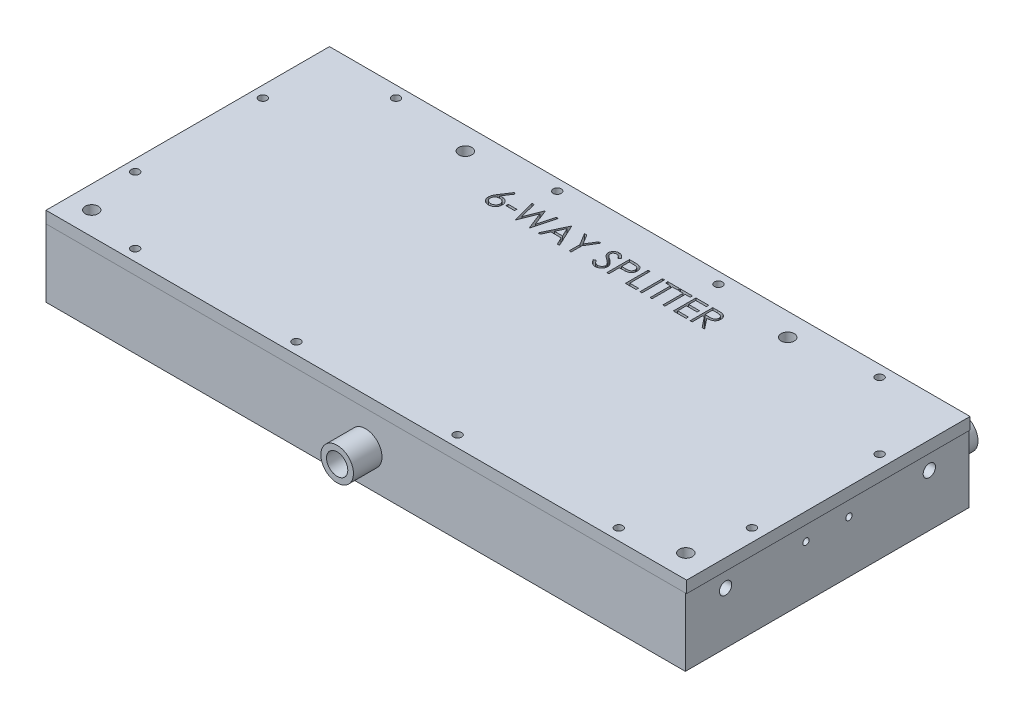
from build123d import *

# Parameters (mm, degrees)
SKETCH1_W                       = 179.324
SKETCH1_H                       = 79.502
SKETCH1_W_2                     = 166.624
SKETCH1_H_2                     = 66.802
EXTRUDE_THIN1_DEPTH             = 19.05
SKETCH10_W                      = 179.324
SKETCH10_H                      = 79.502
BOSS_EXTRUDE1_DEPTH             = 5.715
SKETCH11_W                      = 179.670070945
SKETCH11_H                      = 79.502
BOSS_EXTRUDE2_DEPTH             = 3.302
SKETCH3_W                       = 1.8288
SKETCH3_H                       = 22.352
F_6_CLEARANCE_HOLE1_AT_2_COUNT  = 2
F_6_CLEARANCE_HOLE1_AT_2_PITCH  = 90.424
F_6_CLEARANCE_HOLE1_AT_3_COUNT  = 2
F_6_CLEARANCE_HOLE1_AT_3_PITCH  = 144.78941329
F_6_CLEARANCE_HOLE1_AT_4_COUNT  = 2
F_6_CLEARANCE_HOLE1_AT_4_PITCH  = 76.793005053
SKETCH4_R                       = 4.572
SKETCH4_R_2                     = 2.9845
EXTRUDE_THIN2_DEPTH             = 8.001
SKETCH5_R                       = 4.572
SKETCH5_R_2                     = 2.9845
EXTRUDE_THIN3_DEPTH             = 8.001
SKETCH7_W                       = 1.1303
SKETCH7_H                       = 22.352
F_4_40_TAPPED_HOLE1_AT_2_COUNT  = 2
F_4_40_TAPPED_HOLE1_AT_2_PITCH  = 45.212
F_4_40_TAPPED_HOLE1_AT_3_COUNT  = 2
F_4_40_TAPPED_HOLE1_AT_3_PITCH  = 90.424
F_4_40_TAPPED_HOLE1_AT_4_COUNT  = 2
F_4_40_TAPPED_HOLE1_AT_4_PITCH  = 135.636
F_4_40_TAPPED_HOLE1_AT_5_COUNT  = 2
F_4_40_TAPPED_HOLE1_AT_5_PITCH  = 154.104962931
F_4_40_TAPPED_HOLE1_AT_6_COUNT  = 2
F_4_40_TAPPED_HOLE1_AT_6_PITCH  = 116.308705091
F_4_40_TAPPED_HOLE1_AT_7_COUNT  = 2
F_4_40_TAPPED_HOLE1_AT_7_PITCH  = 85.996162984
F_4_40_TAPPED_HOLE1_AT_8_COUNT  = 2
F_4_40_TAPPED_HOLE1_AT_8_PITCH  = 73.152
F_4_40_TAPPED_HOLE1_AT_9_COUNT  = 2
F_4_40_TAPPED_HOLE1_AT_9_PITCH  = 57.592784704
F_4_40_TAPPED_HOLE1_AT_10_COUNT = 2
F_4_40_TAPPED_HOLE1_AT_10_PITCH = 26.401952996
F_4_40_TAPPED_HOLE1_AT_11_COUNT = 2
F_4_40_TAPPED_HOLE1_AT_11_PITCH = 155.43025634
F_4_40_TAPPED_HOLE1_AT_12_COUNT = 2
F_4_40_TAPPED_HOLE1_AT_12_PITCH = 163.641163263
CUT_EXTRUDE1_DEPTH              = 202.091325786
CUT_EXTRUDE1_DEPTH_BACK         = 202.091325786
SKETCH8_W                       = 2.442307693
SKETCH8_H                       = 0.651282051
SKETCH8_W_2                     = 0.569871795
SKETCH8_H_2                     = 6.35
CUT_EXTRUDE2_DEPTH              = 2.54
F_8_32_TAPPED_HOLE1_AT_2_COUNT  = 2
F_8_32_TAPPED_HOLE1_AT_2_PITCH  = 57.15
F_8_32_TAPPED_HOLE2_AT_2_COUNT  = 2
F_8_32_TAPPED_HOLE2_AT_2_PITCH  = 57.15
F_2_56_TAPPED_HOLE1_AT_2_COUNT  = 2
F_2_56_TAPPED_HOLE1_AT_2_PITCH  = 12.065


with BuildPart() as part:
    # Sketch1 → Extrude-Thin1 (new body)
    with BuildSketch(Plane(origin=(0, 0, 0), x_dir=(1, 0, 0), z_dir=(0, 1, 0))):
        with Locations((89.662, 39.751)):
            Rectangle(SKETCH1_W, SKETCH1_H)
        with Locations((89.662, 39.751)):
            Rectangle(SKETCH1_W_2, SKETCH1_H_2, mode=Mode.SUBTRACT)
    extrude(amount=EXTRUDE_THIN1_DEPTH)

    # Sketch10 → Boss-Extrude1 (add)
    with BuildSketch(Plane.XZ):
        with Locations((89.662, -39.751)):
            Rectangle(SKETCH10_W, SKETCH10_H)
        with BuildLine():
            Line((163.405645816, -23.027113988), (144.931428385, -23.027113988))
            ThreePointArc((144.931428385, -23.027113988), (137.36133977, -15.457025373), (144.931428385, -7.886936759))
            Line((144.931428385, -7.886936759), (163.405645816, -7.886936759))
            ThreePointArc((163.405645816, -7.886936759), (170.975734431, -15.457025373), (163.405645816, -23.027113988))
        make_face(mode=Mode.SUBTRACT)
        with BuildLine():
            Line((123.253940366, -23.027113988), (56.070059634, -23.027113988))
            ThreePointArc((56.070059634, -23.027113988), (48.499971019, -15.457025373), (56.070059634, -7.886936759))
            Line((56.070059634, -7.886936759), (123.253940366, -7.886936759))
            ThreePointArc((123.253940366, -7.886936759), (130.824028981, -15.457025373), (123.253940366, -23.027113988))
        make_face(mode=Mode.SUBTRACT)
        with BuildLine():
            Line((33.865645816, -23.027113988), (15.391428385, -23.027113988))
            ThreePointArc((15.391428385, -23.027113988), (7.82133977, -15.457025373), (15.391428385, -7.886936759))
            Line((15.391428385, -7.886936759), (33.865645816, -7.886936759))
            ThreePointArc((33.865645816, -7.886936759), (41.435734431, -15.457025373), (33.865645816, -23.027113988))
        make_face(mode=Mode.SUBTRACT)
    extrude(amount=-BOSS_EXTRUDE1_DEPTH)


with BuildPart() as body_2:
    # Sketch11 → Boss-Extrude2 (new body)
    with BuildSketch(Plane(origin=(0, 19.05, 0), x_dir=(1, 0, 0), z_dir=(0, 1, 0))):
        with Locations((89.835035473, 39.751)):
            Rectangle(SKETCH11_W, SKETCH11_H)
    extrude(amount=BOSS_EXTRUDE2_DEPTH)


with BuildPart() as f_6_clearance_hole1_tool:
    # Sketch3 → #6 Clearance Hole1 (revolve)
    with BuildSketch(Plane(origin=(44.45, 22.352, -73.152), x_dir=(0, 0, 1), z_dir=(1, 0, 0))):
        with Locations((0.9144, 11.176)):
            Rectangle(SKETCH3_W, SKETCH3_H)
    f_6_clearance_hole1 = revolve(axis=Axis((44.45, 28.702, -73.152), (0, -1, 0)))


with BuildPart() as part_1:
    add(part.part)

    # #6 Clearance Hole1: cut by f_6_clearance_hole1_tool
    add(f_6_clearance_hole1_tool.part, mode=Mode.SUBTRACT)


with BuildPart() as body_2_1:
    add(body_2.part)

    # #6 Clearance Hole1: cut by f_6_clearance_hole1_tool
    add(f_6_clearance_hole1_tool.part, mode=Mode.SUBTRACT)


with BuildPart() as f_6_clearance_hole1_at_2_tool:
    # #6 Clearance Hole1 at 2: #6 Clearance Hole1 ×2
    with Locations(*[(i * F_6_CLEARANCE_HOLE1_AT_2_PITCH, 0, 0) for i in range(1, F_6_CLEARANCE_HOLE1_AT_2_COUNT)]):
        add(f_6_clearance_hole1)


with BuildPart() as part_2:
    add(part_1.part)

    # #6 Clearance Hole1 at 2: cut by f_6_clearance_hole1_at_2_tool
    add(f_6_clearance_hole1_at_2_tool.part, mode=Mode.SUBTRACT)


with BuildPart() as body_2_2:
    add(body_2_1.part)

    # #6 Clearance Hole1 at 2: cut by f_6_clearance_hole1_at_2_tool
    add(f_6_clearance_hole1_at_2_tool.part, mode=Mode.SUBTRACT)


with BuildPart() as f_6_clearance_hole1_at_3_tool:
    # #6 Clearance Hole1 at 3: #6 Clearance Hole1 ×2
    with Locations(*[Vector(0.8876615843601524, 0, 0.46049637528565224) * (i * F_6_CLEARANCE_HOLE1_AT_3_PITCH) for i in range(1, F_6_CLEARANCE_HOLE1_AT_3_COUNT)]):
        add(f_6_clearance_hole1)


with BuildPart() as part_3:
    add(part_2.part)

    # #6 Clearance Hole1 at 3: cut by f_6_clearance_hole1_at_3_tool
    add(f_6_clearance_hole1_at_3_tool.part, mode=Mode.SUBTRACT)


with BuildPart() as body_2_3:
    add(body_2_2.part)

    # #6 Clearance Hole1 at 3: cut by f_6_clearance_hole1_at_3_tool
    add(f_6_clearance_hole1_at_3_tool.part, mode=Mode.SUBTRACT)


with BuildPart() as f_6_clearance_hole1_at_4_tool:
    # #6 Clearance Hole1 at 4: #6 Clearance Hole1 ×2
    with Locations(*[Vector(-0.4961389383568337, 0, 0.8682431421244593) * (i * F_6_CLEARANCE_HOLE1_AT_4_PITCH) for i in range(1, F_6_CLEARANCE_HOLE1_AT_4_COUNT)]):
        add(f_6_clearance_hole1)


with BuildPart() as part_4:
    add(part_3.part)

    # #6 Clearance Hole1 at 4: cut by f_6_clearance_hole1_at_4_tool
    add(f_6_clearance_hole1_at_4_tool.part, mode=Mode.SUBTRACT)

    # Sketch4 → Extrude-Thin2 (add)
    with BuildSketch(Plane.XY):
        with Locations((89.662, 9.525)):
            Circle(SKETCH4_R)
        with Locations((89.662, 9.525)):
            Circle(SKETCH4_R_2, mode=Mode.SUBTRACT)
    extrude(amount=EXTRUDE_THIN2_DEPTH)

    # Sketch5 → Extrude-Thin3 (add)
    # profile 1 of 6: a face of its own
    with BuildSketch(Plane(origin=(0, 0, -79.502), x_dir=(-1, 0, 0), z_dir=(0, 0, -1))):
        with Locations((-10, 9.525)):
            Circle(SKETCH5_R)
        with Locations((-10, 9.525)):
            Circle(SKETCH5_R_2, mode=Mode.SUBTRACT)
    # profile 2 of 6: a face of its own
    with BuildSketch(Plane(origin=(0, 0, -79.502), x_dir=(-1, 0, 0), z_dir=(0, 0, -1))):
        with Locations((-32.606, 9.525)):
            Circle(SKETCH5_R)
        with Locations((-32.606, 9.525)):
            Circle(SKETCH5_R_2, mode=Mode.SUBTRACT)
    # profile 3 of 6: a face of its own
    with BuildSketch(Plane(origin=(0, 0, -79.502), x_dir=(-1, 0, 0), z_dir=(0, 0, -1))):
        with Locations((-55.212, 9.525)):
            Circle(SKETCH5_R)
        with Locations((-55.212, 9.525)):
            Circle(SKETCH5_R_2, mode=Mode.SUBTRACT)
    # profile 4 of 6: a face of its own
    with BuildSketch(Plane(origin=(0, 0, -79.502), x_dir=(-1, 0, 0), z_dir=(0, 0, -1))):
        with Locations((-124.112, 9.525)):
            Circle(SKETCH5_R)
        with Locations((-124.112, 9.525)):
            Circle(SKETCH5_R_2, mode=Mode.SUBTRACT)
    # profile 5 of 6: a face of its own
    with BuildSketch(Plane(origin=(0, 0, -79.502), x_dir=(-1, 0, 0), z_dir=(0, 0, -1))):
        with Locations((-146.718, 9.525)):
            Circle(SKETCH5_R)
        with Locations((-146.718, 9.525)):
            Circle(SKETCH5_R_2, mode=Mode.SUBTRACT)
    # profile 6 of 6: a face of its own
    with BuildSketch(Plane(origin=(0, 0, -79.502), x_dir=(-1, 0, 0), z_dir=(0, 0, -1))):
        with Locations((-169.324, 9.525)):
            Circle(SKETCH5_R)
        with Locations((-169.324, 9.525)):
            Circle(SKETCH5_R_2, mode=Mode.SUBTRACT)
    extrude(amount=EXTRUDE_THIN3_DEPTH)


with BuildPart() as body_2_4:
    add(body_2_3.part)

    # #6 Clearance Hole1 at 4: cut by f_6_clearance_hole1_at_4_tool
    add(f_6_clearance_hole1_at_4_tool.part, mode=Mode.SUBTRACT)


with BuildPart() as f_4_40_tapped_hole1_tool:
    # Sketch7 → #4-40 Tapped Hole1 (revolve)
    with BuildSketch(Plane(origin=(157.48, 22.352, -76.327), x_dir=(0, 0, 1), z_dir=(1, 0, 0))):
        with Locations((0.56515, 11.176)):
            Rectangle(SKETCH7_W, SKETCH7_H)
    f_4_40_tapped_hole1 = revolve(axis=Axis((157.48, 28.702, -76.327), (0, -1, 0)))


with BuildPart() as part_5:
    add(part_4.part)

    # #4-40 Tapped Hole1: cut by f_4_40_tapped_hole1_tool
    add(f_4_40_tapped_hole1_tool.part, mode=Mode.SUBTRACT)


with BuildPart() as body_2_5:
    add(body_2_4.part)

    # #4-40 Tapped Hole1: cut by f_4_40_tapped_hole1_tool
    add(f_4_40_tapped_hole1_tool.part, mode=Mode.SUBTRACT)


with BuildPart() as f_4_40_tapped_hole1_at_2_tool:
    # #4-40 Tapped Hole1 at 2: #4-40 Tapped Hole1 ×2
    with Locations(*[(-i * F_4_40_TAPPED_HOLE1_AT_2_PITCH, 0, 0) for i in range(1, F_4_40_TAPPED_HOLE1_AT_2_COUNT)]):
        add(f_4_40_tapped_hole1)


with BuildPart() as part_6:
    add(part_5.part)

    # #4-40 Tapped Hole1 at 2: cut by f_4_40_tapped_hole1_at_2_tool
    add(f_4_40_tapped_hole1_at_2_tool.part, mode=Mode.SUBTRACT)


with BuildPart() as body_2_6:
    add(body_2_5.part)

    # #4-40 Tapped Hole1 at 2: cut by f_4_40_tapped_hole1_at_2_tool
    add(f_4_40_tapped_hole1_at_2_tool.part, mode=Mode.SUBTRACT)


with BuildPart() as f_4_40_tapped_hole1_at_3_tool:
    # #4-40 Tapped Hole1 at 3: #4-40 Tapped Hole1 ×2
    with Locations(*[(-i * F_4_40_TAPPED_HOLE1_AT_3_PITCH, 0, 0) for i in range(1, F_4_40_TAPPED_HOLE1_AT_3_COUNT)]):
        add(f_4_40_tapped_hole1)


with BuildPart() as part_7:
    add(part_6.part)

    # #4-40 Tapped Hole1 at 3: cut by f_4_40_tapped_hole1_at_3_tool
    add(f_4_40_tapped_hole1_at_3_tool.part, mode=Mode.SUBTRACT)


with BuildPart() as body_2_7:
    add(body_2_6.part)

    # #4-40 Tapped Hole1 at 3: cut by f_4_40_tapped_hole1_at_3_tool
    add(f_4_40_tapped_hole1_at_3_tool.part, mode=Mode.SUBTRACT)


with BuildPart() as f_4_40_tapped_hole1_at_4_tool:
    # #4-40 Tapped Hole1 at 4: #4-40 Tapped Hole1 ×2
    with Locations(*[(-i * F_4_40_TAPPED_HOLE1_AT_4_PITCH, 0, 0) for i in range(1, F_4_40_TAPPED_HOLE1_AT_4_COUNT)]):
        add(f_4_40_tapped_hole1)


with BuildPart() as part_8:
    add(part_7.part)

    # #4-40 Tapped Hole1 at 4: cut by f_4_40_tapped_hole1_at_4_tool
    add(f_4_40_tapped_hole1_at_4_tool.part, mode=Mode.SUBTRACT)


with BuildPart() as body_2_8:
    add(body_2_7.part)

    # #4-40 Tapped Hole1 at 4: cut by f_4_40_tapped_hole1_at_4_tool
    add(f_4_40_tapped_hole1_at_4_tool.part, mode=Mode.SUBTRACT)


with BuildPart() as f_4_40_tapped_hole1_at_5_tool:
    # #4-40 Tapped Hole1 at 5: #4-40 Tapped Hole1 ×2
    with Locations(*[Vector(-0.8801533540527848, 0, 0.47468944937678276) * (i * F_4_40_TAPPED_HOLE1_AT_5_PITCH) for i in range(1, F_4_40_TAPPED_HOLE1_AT_5_COUNT)]):
        add(f_4_40_tapped_hole1)


with BuildPart() as part_9:
    add(part_8.part)

    # #4-40 Tapped Hole1 at 5: cut by f_4_40_tapped_hole1_at_5_tool
    add(f_4_40_tapped_hole1_at_5_tool.part, mode=Mode.SUBTRACT)


with BuildPart() as body_2_9:
    add(body_2_8.part)

    # #4-40 Tapped Hole1 at 5: cut by f_4_40_tapped_hole1_at_5_tool
    add(f_4_40_tapped_hole1_at_5_tool.part, mode=Mode.SUBTRACT)


with BuildPart() as f_4_40_tapped_hole1_at_6_tool:
    # #4-40 Tapped Hole1 at 6: #4-40 Tapped Hole1 ×2
    with Locations(*[Vector(-0.7774482565949737, 0, 0.628946904211664) * (i * F_4_40_TAPPED_HOLE1_AT_6_PITCH) for i in range(1, F_4_40_TAPPED_HOLE1_AT_6_COUNT)]):
        add(f_4_40_tapped_hole1)


with BuildPart() as part_10:
    add(part_9.part)

    # #4-40 Tapped Hole1 at 6: cut by f_4_40_tapped_hole1_at_6_tool
    add(f_4_40_tapped_hole1_at_6_tool.part, mode=Mode.SUBTRACT)


with BuildPart() as body_2_10:
    add(body_2_9.part)

    # #4-40 Tapped Hole1 at 6: cut by f_4_40_tapped_hole1_at_6_tool
    add(f_4_40_tapped_hole1_at_6_tool.part, mode=Mode.SUBTRACT)


with BuildPart() as f_4_40_tapped_hole1_at_7_tool:
    # #4-40 Tapped Hole1 at 7: #4-40 Tapped Hole1 ×2
    with Locations(*[Vector(-0.5257443870876233, 0, 0.8506426038271652) * (i * F_4_40_TAPPED_HOLE1_AT_7_PITCH) for i in range(1, F_4_40_TAPPED_HOLE1_AT_7_COUNT)]):
        add(f_4_40_tapped_hole1)


with BuildPart() as part_11:
    add(part_10.part)

    # #4-40 Tapped Hole1 at 7: cut by f_4_40_tapped_hole1_at_7_tool
    add(f_4_40_tapped_hole1_at_7_tool.part, mode=Mode.SUBTRACT)


with BuildPart() as body_2_11:
    add(body_2_10.part)

    # #4-40 Tapped Hole1 at 7: cut by f_4_40_tapped_hole1_at_7_tool
    add(f_4_40_tapped_hole1_at_7_tool.part, mode=Mode.SUBTRACT)


with BuildPart() as f_4_40_tapped_hole1_at_8_tool:
    # #4-40 Tapped Hole1 at 8: #4-40 Tapped Hole1 ×2
    with Locations(*[(0, 0, i * F_4_40_TAPPED_HOLE1_AT_8_PITCH) for i in range(1, F_4_40_TAPPED_HOLE1_AT_8_COUNT)]):
        add(f_4_40_tapped_hole1)


with BuildPart() as part_12:
    add(part_11.part)

    # #4-40 Tapped Hole1 at 8: cut by f_4_40_tapped_hole1_at_8_tool
    add(f_4_40_tapped_hole1_at_8_tool.part, mode=Mode.SUBTRACT)


with BuildPart() as body_2_12:
    add(body_2_11.part)

    # #4-40 Tapped Hole1 at 8: cut by f_4_40_tapped_hole1_at_8_tool
    add(f_4_40_tapped_hole1_at_8_tool.part, mode=Mode.SUBTRACT)


with BuildPart() as f_4_40_tapped_hole1_at_9_tool:
    # #4-40 Tapped Hole1 at 9: #4-40 Tapped Hole1 ×2
    with Locations(*[Vector(0.3241551888112543, 0, 0.9460039183675405) * (i * F_4_40_TAPPED_HOLE1_AT_9_PITCH) for i in range(1, F_4_40_TAPPED_HOLE1_AT_9_COUNT)]):
        add(f_4_40_tapped_hole1)


with BuildPart() as part_13:
    add(part_12.part)

    # #4-40 Tapped Hole1 at 9: cut by f_4_40_tapped_hole1_at_9_tool
    add(f_4_40_tapped_hole1_at_9_tool.part, mode=Mode.SUBTRACT)


with BuildPart() as body_2_13:
    add(body_2_12.part)

    # #4-40 Tapped Hole1 at 9: cut by f_4_40_tapped_hole1_at_9_tool
    add(f_4_40_tapped_hole1_at_9_tool.part, mode=Mode.SUBTRACT)


with BuildPart() as f_4_40_tapped_hole1_at_10_tool:
    # #4-40 Tapped Hole1 at 10: #4-40 Tapped Hole1 ×2
    with Locations(*[Vector(0.7071067811865487, 0, 0.7071067811865465) * (i * F_4_40_TAPPED_HOLE1_AT_10_PITCH) for i in range(1, F_4_40_TAPPED_HOLE1_AT_10_COUNT)]):
        add(f_4_40_tapped_hole1)


with BuildPart() as part_14:
    add(part_13.part)

    # #4-40 Tapped Hole1 at 10: cut by f_4_40_tapped_hole1_at_10_tool
    add(f_4_40_tapped_hole1_at_10_tool.part, mode=Mode.SUBTRACT)


with BuildPart() as body_2_14:
    add(body_2_13.part)

    # #4-40 Tapped Hole1 at 10: cut by f_4_40_tapped_hole1_at_10_tool
    add(f_4_40_tapped_hole1_at_10_tool.part, mode=Mode.SUBTRACT)


with BuildPart() as f_4_40_tapped_hole1_at_11_tool:
    # #4-40 Tapped Hole1 at 11: #4-40 Tapped Hole1 ×2
    with Locations(*[Vector(-0.9927603777619716, 0, 0.12011174940823857) * (i * F_4_40_TAPPED_HOLE1_AT_11_PITCH) for i in range(1, F_4_40_TAPPED_HOLE1_AT_11_COUNT)]):
        add(f_4_40_tapped_hole1)


with BuildPart() as part_15:
    add(part_14.part)

    # #4-40 Tapped Hole1 at 11: cut by f_4_40_tapped_hole1_at_11_tool
    add(f_4_40_tapped_hole1_at_11_tool.part, mode=Mode.SUBTRACT)


with BuildPart() as body_2_15:
    add(body_2_14.part)

    # #4-40 Tapped Hole1 at 11: cut by f_4_40_tapped_hole1_at_11_tool
    add(f_4_40_tapped_hole1_at_11_tool.part, mode=Mode.SUBTRACT)


with BuildPart() as f_4_40_tapped_hole1_at_12_tool:
    # #4-40 Tapped Hole1 at 12: #4-40 Tapped Hole1 ×2
    with Locations(*[Vector(-0.9429473423639763, 0, 0.3329419011309842) * (i * F_4_40_TAPPED_HOLE1_AT_12_PITCH) for i in range(1, F_4_40_TAPPED_HOLE1_AT_12_COUNT)]):
        add(f_4_40_tapped_hole1)


with BuildPart() as part_16:
    add(part_15.part)

    # #4-40 Tapped Hole1 at 12: cut by f_4_40_tapped_hole1_at_12_tool
    add(f_4_40_tapped_hole1_at_12_tool.part, mode=Mode.SUBTRACT)


with BuildPart() as body_2_16:
    add(body_2_15.part)

    # #4-40 Tapped Hole1 at 12: cut by f_4_40_tapped_hole1_at_12_tool
    add(f_4_40_tapped_hole1_at_12_tool.part, mode=Mode.SUBTRACT)


with BuildPart() as cut_extrude1_tool:
    # Sketch8 → Cut-Extrude1 (new, two sides: drawn at the far end of the back side and taken through both)
    # profile 1 of 13: a face of its own
    with BuildSketch(Plane(origin=(0, 22.352, 0), x_dir=(1, 0, 0), z_dir=(0, 1, 0)).offset(-CUT_EXTRUDE1_DEPTH_BACK)):
        with BuildLine():
            Line((61.399615385, 70.012820513), (61.838467548, 69.668098958))
            Line((61.838467548, 69.668098958), (60.160653045, 67.102403846))
            add(Edge.make_bspline(
                [(60.160653045, 67.102403846), (60.272359119, 67.120208993), (60.490254446, 67.154939946), (60.710809719, 67.160669361), (60.818295272, 67.163461538)],
                knots=[0, 0, 0, 0, 1.025318673, 2, 2, 2, 2], degree=3))
            add(Edge.make_bspline(
                [(60.818295272, 67.163461538), (60.882833944, 67.161726879), (61.009876399, 67.158312252), (61.196397312, 67.132034409), (61.375628667, 67.090623135), (61.546827592, 67.030257756), (61.710608574, 66.953146342), (61.867911492, 66.860728677), (62.015779425, 66.748232657), (62.156116564, 66.622566237), (62.283528584, 66.483379708), (62.396333713, 66.335694426), (62.491088035, 66.179664256), (62.567966436, 66.015368228), (62.627665287, 65.8430596), (62.671185729, 65.662958832), (62.696911562, 65.474941734), (62.700404952, 65.347074188), (62.702179487, 65.282121394)],
                knots=[0, 0, 0, 0, 1.04369286, 2.054478336, 3.041073146, 4.015093852, 4.984733326, 5.965804835, 6.960378782, 7.985147595, 9.009457201, 10.008161701, 10.986880575, 11.956520048, 12.937015923, 13.931873656, 14.949455224, 16, 16, 16, 16], degree=3))
            add(Edge.make_bspline(
                [(62.702179487, 65.282121394), (62.699597568, 65.193258217), (62.694516963, 65.018396515), (62.643891505, 64.763713062), (62.56522472, 64.521084069), (62.452779776, 64.294383315), (62.313111738, 64.08392151), (62.142790963, 63.897439309), (61.947857777, 63.73112367), (61.727446015, 63.592046661), (61.490240923, 63.47846684), (61.241045156, 63.396887043), (60.982278762, 63.34666132), (60.806647544, 63.340364655), (60.717804487, 63.337179487)],
                knots=[0, 0, 0, 0, 1.031375318, 2.029502543, 3.004789286, 3.987476834, 4.960371455, 5.9300674, 6.912260825, 7.929083631, 8.949397511, 9.960523116, 10.96833055, 12, 12, 12, 12], degree=3))
            add(Edge.make_bspline(
                [(60.717804487, 63.337179487), (60.632357616, 63.339952089), (60.463102325, 63.345444128), (60.214122827, 63.394368044), (59.974885638, 63.473665216), (59.747066904, 63.582911121), (59.536028078, 63.720901852), (59.34722328, 63.887021987), (59.181593918, 64.077720588), (59.043754248, 64.292968075), (58.934427692, 64.524271283), (58.852440256, 64.765457267), (58.804549929, 65.015647234), (58.797857833, 65.185248729), (58.794487179, 65.270673077)],
                knots=[0, 0, 0, 0, 1.012016664, 2.004627821, 2.994792927, 3.992885782, 4.990978636, 5.973936114, 6.964471063, 7.975201453, 8.993600317, 9.990122807, 10.98767138, 12, 12, 12, 12], degree=3))
            add(Edge.make_bspline(
                [(58.794487179, 65.270673077), (58.796630658, 65.336068249), (58.801007232, 65.469592697), (58.831565955, 65.67182029), (58.880669225, 65.878741538), (58.935660672, 66.05428129), (58.993764279, 66.198084337), (59.042119601, 66.314023527), (59.102306708, 66.433332902), (59.166484128, 66.560103642), (59.240428733, 66.691068641), (59.320829983, 66.828416727), (59.409910778, 66.969963539), (59.472358788, 67.066019436), (59.504282853, 67.115124199)],
                knots=[0, 0, 0, 0, 1.173818275, 2.396712641, 3.66331629, 4.989737886, 5.693666774, 6.447286557, 7.243889047, 8.091586357, 8.998013824, 9.943181721, 10.948533338, 12, 12, 12, 12], degree=3))
            Line((59.504282853, 67.115124199), (61.399615385, 70.012820513))
        make_face()
        with BuildLine():
            add(Edge.make_bspline(
                [(60.698723958, 66.512179487), (60.650351028, 66.510767894), (60.555864644, 66.508010641), (60.417239763, 66.491999113), (60.286042864, 66.46184738), (60.160535779, 66.423445606), (60.043064946, 66.37064434), (59.932776623, 66.306506077), (59.829244314, 66.230993368), (59.733552442, 66.145176), (59.64679391, 66.051217712), (59.572079573, 65.95058015), (59.507631789, 65.845688668), (59.455231918, 65.735666858), (59.414428495, 65.62055678), (59.38491324, 65.500887856), (59.368487148, 65.375857615), (59.365754414, 65.291071503), (59.364358974, 65.247776442)],
                knots=[0, 0, 0, 0, 1.129588631, 2.206414736, 3.251139165, 4.268635594, 5.265702196, 6.250456724, 7.242448911, 8.251968645, 9.246821453, 10.222880186, 11.173611482, 12.116736599, 13.062300278, 14.020270554, 14.989073742, 16, 16, 16, 16], degree=3))
            add(Edge.make_bspline(
                [(59.364358974, 65.247776442), (59.365495373, 65.204868622), (59.367723682, 65.120732773), (59.387957176, 64.996745976), (59.418863683, 64.877429642), (59.464838401, 64.763398884), (59.519678612, 64.652915564), (59.592078272, 64.549981547), (59.672300155, 64.448345134), (59.768192291, 64.355813893), (59.871104678, 64.269714017), (59.981052574, 64.194456986), (60.095642787, 64.130074928), (60.216422367, 64.079617651), (60.341677721, 64.038207874), (60.472452441, 64.009067761), (60.608837478, 63.992593093), (60.701224423, 63.989856799), (60.748333333, 63.988461538)],
                knots=[0, 0, 0, 0, 0.989467248, 1.94019797, 2.891935182, 3.827694429, 4.772920941, 5.730924762, 6.725747692, 7.756678648, 8.79901574, 9.819492441, 10.826891316, 11.826466727, 12.835195252, 13.867842842, 14.912794438, 16, 16, 16, 16], degree=3))
            add(Edge.make_bspline(
                [(60.748333333, 63.988461538), (60.795442166, 63.989856908), (60.88782896, 63.992593417), (61.024215095, 64.00906653), (61.154985758, 64.038212392), (61.280255853, 64.079601275), (61.40098102, 64.130135681), (61.515471015, 64.194056449), (61.624379128, 64.270176834), (61.727359073, 64.355666754), (61.822852075, 64.448871786), (61.904997995, 64.549074282), (61.975180433, 64.653747492), (62.032211029, 64.762963664), (62.077679372, 64.877498591), (62.108742605, 64.996727505), (62.128934315, 65.120737609), (62.131168366, 65.204870255), (62.132307692, 65.247776442)],
                knots=[0, 0, 0, 0, 1.087397944, 2.132534446, 3.165364764, 4.174271784, 5.174024072, 6.181601208, 7.194203697, 8.236725232, 9.267838612, 10.269026844, 11.221737037, 12.171628256, 13.107553087, 14.05945871, 15.010357665, 16, 16, 16, 16], degree=3))
            add(Edge.make_bspline(
                [(62.132307692, 65.247776442), (62.131309304, 65.291127985), (62.129349791, 65.376212964), (62.10718657, 65.500831928), (62.076448263, 65.621164802), (62.030033336, 65.73645531), (61.969732748, 65.846248492), (61.896284281, 65.951098968), (61.811316618, 66.051810598), (61.713168224, 66.145360265), (61.606324514, 66.230898535), (61.492721952, 66.306408301), (61.373871771, 66.370135045), (61.249894476, 66.423306502), (61.119369531, 66.461677691), (60.984404202, 66.491891432), (60.84327229, 66.507969664), (60.747520444, 66.510758339), (60.698723958, 66.512179487)],
                knots=[0, 0, 0, 0, 0.978206639, 1.919901502, 2.851605144, 3.780102724, 4.718870031, 5.675451981, 6.667674623, 7.690630536, 8.733308323, 9.756129687, 10.767539656, 11.776269907, 12.797430371, 13.836405707, 14.897401972, 16, 16, 16, 16], degree=3))
        make_face(mode=Mode.SUBTRACT)
    # profile 2 of 13: a face of its own
    with BuildSketch(Plane(origin=(0, 22.352, 0), x_dir=(1, 0, 0), z_dir=(0, 1, 0)).offset(-CUT_EXTRUDE1_DEPTH_BACK)):
        with Locations((64.574615385, 65.942307693)):
            Rectangle(SKETCH8_W, SKETCH8_H)
    # profile 3 of 13: a face of its own
    with BuildSketch(Plane(origin=(0, 22.352, 0), x_dir=(1, 0, 0), z_dir=(0, 1, 0)).offset(-CUT_EXTRUDE1_DEPTH_BACK)):
        Polygon((66.447051282, 69.85), (67.036003606, 69.85), (68.278782051, 65.193078926), (70.127049279, 69.85), (70.209731571, 69.85), (72.023653846, 65.224879808), (73.272792468, 69.85), (73.855384615, 69.85), (72.14322516, 63.5), (72.061814904, 63.5), (70.151217949, 68.356630609), (68.217724359, 63.5), (68.136314103, 63.5), align=None)
    # profile 4 of 13: a face of its own
    with BuildSketch(Plane(origin=(0, 22.352, 0), x_dir=(1, 0, 0), z_dir=(0, 1, 0)).offset(-CUT_EXTRUDE1_DEPTH_BACK)):
        Polygon((77.60025641, 69.85), (80.531025641, 63.5), (79.911544471, 63.5), (78.972782452, 65.53525641), (76.094166667, 65.53525641), (75.128691907, 63.5), (74.506666667, 63.5), (77.518846154, 69.85), align=None)
        Polygon((77.553191106, 68.612309696), (76.403271234, 66.186538462), (78.672582131, 66.186538462), align=None, mode=Mode.SUBTRACT)
    # profile 5 of 13: a face of its own
    with BuildSketch(Plane(origin=(0, 22.352, 0), x_dir=(1, 0, 0), z_dir=(0, 1, 0)).offset(-CUT_EXTRUDE1_DEPTH_BACK)):
        Polygon((81.182307692, 69.85), (81.834861779, 69.85), (83.503772035, 67.121484375), (85.170138221, 69.85), (85.822692308, 69.85), (83.787435897, 66.518539663), (83.787435897, 63.5), (83.217564103, 63.5), (83.217564103, 66.518539663), align=None)
    # profile 6 of 13: a face of its own
    with BuildSketch(Plane(origin=(0, 22.352, 0), x_dir=(1, 0, 0), z_dir=(0, 1, 0)).offset(-CUT_EXTRUDE1_DEPTH_BACK)):
        with BuildLine():
            Line((88.753461538, 64.724969952), (89.290260417, 65.046794872))
            add(Edge.make_bspline(
                [(89.290260417, 65.046794872), (89.340186361, 64.963220916), (89.435842545, 64.803096443), (89.595411439, 64.586728284), (89.760752578, 64.402828371), (89.933090369, 64.252466525), (90.111372875, 64.134086402), (90.296763944, 64.050262353), (90.488638829, 63.997981941), (90.619219905, 63.991631784), (90.684411058, 63.988461538)],
                knots=[0, 0, 0, 0, 1.272034388, 2.437168799, 3.508375237, 4.49857839, 5.41946034, 6.295179144, 7.148887113, 8, 8, 8, 8], degree=3))
            add(Edge.make_bspline(
                [(90.684411058, 63.988461538), (90.74008579, 63.990012159), (90.850461079, 63.993086267), (91.012952577, 64.022624293), (91.170762418, 64.068003441), (91.320638089, 64.132992846), (91.460511561, 64.211621241), (91.583169423, 64.306592163), (91.689207371, 64.412920565), (91.775946764, 64.531543381), (91.842494828, 64.65911878), (91.893643295, 64.790066577), (91.922027929, 64.926443837), (91.926303753, 65.018265676), (91.928461538, 65.064603365)],
                knots=[0, 0, 0, 0, 1.095163259, 2.171163733, 3.241058638, 4.321873601, 5.38011039, 6.391990106, 7.366004449, 8.327778327, 9.272591725, 10.192022065, 11.087607919, 12, 12, 12, 12], degree=3))
            add(Edge.make_bspline(
                [(91.928461538, 65.064603365), (91.925786718, 65.117473193), (91.920349198, 65.224949826), (91.874390655, 65.383517768), (91.802092736, 65.540440002), (91.735394797, 65.637506584), (91.700767228, 65.687900641)],
                knots=[0, 0, 0, 0, 0.938893495, 1.908633276, 2.914225137, 4, 4, 4, 4], degree=3))
            add(Edge.make_bspline(
                [(91.700767228, 65.687900641), (91.672336256, 65.724271307), (91.612648988, 65.80062697), (91.510037501, 65.914283326), (91.389630408, 66.0315196), (91.255548244, 66.15681246), (91.102906783, 66.284334606), (90.936486864, 66.420167053), (90.752039577, 66.5591442), (90.622681918, 66.652348712), (90.555935497, 66.700440705)],
                knots=[0, 0, 0, 0, 0.722233717, 1.516239348, 2.393582979, 3.351407094, 4.387010283, 5.505090956, 6.712668013, 8, 8, 8, 8], degree=3))
            add(Edge.make_bspline(
                [(90.555935497, 66.700440705), (90.489126247, 66.748026857), (90.361392048, 66.839007956), (90.182760048, 66.974034871), (90.023022237, 67.097485891), (89.882888593, 67.21052317), (89.762420753, 67.313162039), (89.660669421, 67.404416871), (89.58022661, 67.486755618), (89.535494343, 67.540170623), (89.515410657, 67.564152644)],
                knots=[0, 0, 0, 0, 1.452282411, 2.77665338, 3.964542531, 5.026858415, 5.96415736, 6.766646006, 7.446254459, 8, 8, 8, 8], degree=3))
            add(Edge.make_bspline(
                [(89.515410657, 67.564152644), (89.487339039, 67.601528811), (89.432132436, 67.675034059), (89.359259826, 67.789923444), (89.29732163, 67.907531369), (89.248767113, 68.028173866), (89.207879973, 68.150157237), (89.180379156, 68.275073068), (89.16315905, 68.402360847), (89.161395589, 68.488019627), (89.160512821, 68.530899439)],
                knots=[0, 0, 0, 0, 1.068054152, 2.10047183, 3.106115577, 4.101338837, 5.06977816, 6.043150881, 7.020423561, 8, 8, 8, 8], degree=3))
            add(Edge.make_bspline(
                [(89.160512821, 68.530899439), (89.162880843, 68.59808203), (89.167566272, 68.731011231), (89.20719121, 68.925195738), (89.269734889, 69.110591095), (89.357355614, 69.285361843), (89.47030824, 69.444957266), (89.601020222, 69.591213164), (89.756706776, 69.714164734), (89.927526535, 69.821592326), (90.114500239, 69.905677076), (90.310426592, 69.969106283), (90.515616994, 70.005045936), (90.654596967, 70.010203524), (90.725116186, 70.012820513)],
                knots=[0, 0, 0, 0, 1.005424448, 1.989358655, 2.955360095, 3.929531133, 4.905563448, 5.876582895, 6.856512386, 7.866279853, 8.892233794, 9.918561126, 10.94386622, 12, 12, 12, 12], degree=3))
            add(Edge.make_bspline(
                [(90.725116186, 70.012820513), (90.799944768, 70.010239598), (90.948754935, 70.005106981), (91.167647083, 69.960480032), (91.378395811, 69.886637384), (91.547928592, 69.802837962), (91.680612316, 69.719142394), (91.781799988, 69.642906427), (91.884338792, 69.555140158), (91.989055834, 69.455609812), (92.094176745, 69.343402135), (92.201262151, 69.219285599), (92.310562467, 69.084018705), (92.380876671, 68.987454254), (92.416923077, 68.937950721)],
                knots=[0, 0, 0, 0, 1.286793592, 2.559021753, 3.825965368, 5.121522368, 5.803751409, 6.523245864, 7.299691795, 8.125521123, 9.008227632, 9.944561021, 10.946284179, 12, 12, 12, 12], degree=3))
            Line((92.416923077, 68.937950721), (91.901748798, 68.547435897))
            add(Edge.make_bspline(
                [(91.901748798, 68.547435897), (91.870641178, 68.587511093), (91.810735174, 68.664686549), (91.719785962, 68.772765936), (91.634063415, 68.871492978), (91.54960769, 68.957245424), (91.470879244, 69.034719295), (91.394466896, 69.101049139), (91.321470288, 69.156884863), (91.229455321, 69.216472464), (91.113853175, 69.275539263), (90.968738374, 69.325521162), (90.817088989, 69.355556775), (90.713802372, 69.359528042), (90.661514423, 69.361538462)],
                knots=[0, 0, 0, 0, 1.181633172, 2.275549214, 3.290209073, 4.226197932, 5.078386478, 5.862611352, 6.581680152, 7.217281963, 8.414376989, 9.595101626, 10.782541182, 12, 12, 12, 12], degree=3))
            add(Edge.make_bspline(
                [(90.661514423, 69.361538462), (90.595916161, 69.359340092), (90.469416092, 69.355100742), (90.289819521, 69.308800198), (90.128177685, 69.235898822), (89.98928946, 69.133727362), (89.873652373, 69.012676418), (89.790003898, 68.873377638), (89.739657171, 68.719558137), (89.733513492, 68.612258274), (89.730384615, 68.557612179)],
                knots=[0, 0, 0, 0, 1.14458467, 2.207223713, 3.21896685, 4.227309161, 5.202851033, 6.127160689, 7.046193047, 8, 8, 8, 8], degree=3))
            add(Edge.make_bspline(
                [(89.730384615, 68.557612179), (89.731097859, 68.52359164), (89.732525514, 68.45549493), (89.752436932, 68.354890208), (89.778017144, 68.254539635), (89.818553061, 68.154894377), (89.874515255, 68.054211754), (89.948003217, 67.950758031), (90.04055594, 67.843621359), (90.111452805, 67.77393941), (90.148884215, 67.737149439)],
                knots=[0, 0, 0, 0, 0.858281714, 1.717966888, 2.583508476, 3.4729293, 4.427298488, 5.488583878, 6.674047936, 8, 8, 8, 8], degree=3))
            add(Edge.make_bspline(
                [(90.148884215, 67.737149439), (90.162784133, 67.724745121), (90.195807158, 67.6952753), (90.256179195, 67.647029305), (90.335903986, 67.587515704), (90.432899694, 67.513878716), (90.548954764, 67.428459491), (90.684081959, 67.332350224), (90.836775026, 67.222430891), (90.945127644, 67.14558221), (91.002419872, 67.104947917)],
                knots=[0, 0, 0, 0, 0.420754252, 0.999615792, 1.744751191, 2.668019286, 3.750313428, 4.999500688, 6.413464383, 8, 8, 8, 8], degree=3))
            add(Edge.make_bspline(
                [(91.002419872, 67.104947917), (91.071337172, 67.054798593), (91.204785971, 66.957691378), (91.394664723, 66.811794359), (91.566829204, 66.669104836), (91.721883873, 66.530534034), (91.86136055, 66.397133065), (91.983711843, 66.26729701), (92.090184434, 66.141956042), (92.204809588, 65.981260083), (92.321935918, 65.783900116), (92.422522652, 65.542095312), (92.485947083, 65.299350559), (92.494241118, 65.136197584), (92.498333333, 65.055699119)],
                knots=[0, 0, 0, 0, 1.163667725, 2.253281268, 3.268753668, 4.215851969, 5.092017293, 5.902905408, 6.650798638, 7.335211899, 8.59617414, 9.77448103, 10.901945474, 12, 12, 12, 12], degree=3))
            add(Edge.make_bspline(
                [(92.498333333, 65.055699119), (92.497141097, 64.998769799), (92.494779777, 64.886016689), (92.467636405, 64.720453907), (92.427867869, 64.559652186), (92.367928888, 64.405599168), (92.294771158, 64.255476527), (92.201940965, 64.113222193), (92.09433988, 63.975687727), (91.970907192, 63.846540536), (91.835841055, 63.727983866), (91.693086352, 63.62252114), (91.542409428, 63.534585753), (91.384627682, 63.462829226), (91.219704871, 63.406706987), (91.047696464, 63.366043638), (90.868318922, 63.341086848), (90.746398048, 63.338496481), (90.684411058, 63.337179487)],
                knots=[0, 0, 0, 0, 0.983748083, 1.948392443, 2.894712957, 3.844097841, 4.80183111, 5.778335162, 6.776009319, 7.81870978, 8.863265674, 9.881300176, 10.883814829, 11.87499822, 12.874611388, 13.892143829, 14.928324115, 16, 16, 16, 16], degree=3))
            add(Edge.make_bspline(
                [(90.684411058, 63.337179487), (90.636449793, 63.338106917), (90.541131285, 63.339950096), (90.400144082, 63.356244704), (90.262005113, 63.379299021), (90.128447773, 63.415900548), (89.997751326, 63.460308778), (89.870484201, 63.514988324), (89.746584717, 63.580515246), (89.625358531, 63.65543622), (89.507113957, 63.742626699), (89.392960065, 63.844178614), (89.2791514, 63.957291173), (89.169047124, 64.085036052), (89.060420134, 64.225349431), (88.955412162, 64.379544093), (88.851849617, 64.546780149), (88.786870126, 64.664463947), (88.753461538, 64.724969952)],
                knots=[0, 0, 0, 0, 0.915332311, 1.819136955, 2.706846663, 3.586547465, 4.459518054, 5.340707479, 6.227863349, 7.133153174, 8.059268498, 9.028702269, 10.047606654, 11.120612155, 12.245963614, 13.433783089, 14.680604001, 16, 16, 16, 16], degree=3))
        make_face()
    # profile 7 of 13: a face of its own
    with BuildSketch(Plane(origin=(0, 22.352, 0), x_dir=(1, 0, 0), z_dir=(0, 1, 0)).offset(-CUT_EXTRUDE1_DEPTH_BACK)):
        with BuildLine():
            Line((93.800897436, 69.85), (95.046219952, 69.85))
            add(Edge.make_bspline(
                [(95.046219952, 69.85), (95.131874025, 69.849905845), (95.295991031, 69.849725441), (95.531331204, 69.844255831), (95.745071717, 69.836950261), (95.936751694, 69.826823112), (96.1069609, 69.814855012), (96.254929144, 69.798069169), (96.381819482, 69.780542633), (96.457849754, 69.762723796), (96.492524038, 69.754597356)],
                knots=[0, 0, 0, 0, 1.415646017, 2.712440637, 3.8905458, 4.950247383, 5.884950622, 6.709939814, 7.411656543, 8, 8, 8, 8], degree=3))
            add(Edge.make_bspline(
                [(96.492524038, 69.754597356), (96.536418021, 69.742583247), (96.62317168, 69.718838126), (96.748177858, 69.671278942), (96.867111263, 69.614887014), (96.980379948, 69.550617866), (97.086592013, 69.475714057), (97.187332116, 69.393211922), (97.281711223, 69.301206647), (97.369198605, 69.200730162), (97.449543881, 69.09346921), (97.51872202, 68.977822593), (97.576647132, 68.855736942), (97.62632821, 68.727297177), (97.662084977, 68.591424733), (97.689021495, 68.449063698), (97.706118648, 68.300229332), (97.707756153, 68.198520715), (97.708589744, 68.146744792)],
                knots=[0, 0, 0, 0, 0.999701418, 1.975846123, 2.934577507, 3.890451536, 4.834027766, 5.787354733, 6.749476667, 7.726910423, 8.712836071, 9.690891519, 10.682875813, 11.679750201, 12.712814741, 13.765529915, 14.8625177, 16, 16, 16, 16], degree=3))
            add(Edge.make_bspline(
                [(97.708589744, 68.146744792), (97.707825159, 68.094533682), (97.706329197, 67.992379121), (97.688374508, 67.842931348), (97.664189731, 67.700113697), (97.627002222, 67.564242837), (97.578296501, 67.436125653), (97.521160919, 67.313804275), (97.452247943, 67.199359728), (97.373063752, 67.092376529), (97.284977288, 66.992754259), (97.188361243, 66.901214846), (97.083605669, 66.818294118), (96.971043486, 66.74380618), (96.849577332, 66.679478359), (96.721049425, 66.621861534), (96.584342604, 66.57347261), (96.489741185, 66.54801807), (96.441642628, 66.535076122)],
                knots=[0, 0, 0, 0, 1.121902311, 2.195077645, 3.232258892, 4.234102512, 5.217864754, 6.176164875, 7.132989551, 8.084763148, 9.034132444, 9.988522005, 10.94243251, 11.903244335, 12.886203696, 13.894208494, 14.929344452, 16, 16, 16, 16], degree=3))
            add(Edge.make_bspline(
                [(96.441642628, 66.535076122), (96.401860179, 66.526616142), (96.31467463, 66.508075604), (96.17108712, 66.487377404), (96.003909062, 66.469710614), (95.81336864, 66.456464264), (95.599636884, 66.44512431), (95.362598174, 66.436110768), (95.101787206, 66.431158033), (94.91986652, 66.430902595), (94.824885817, 66.430769231)],
                knots=[0, 0, 0, 0, 0.601384939, 1.31797006, 2.144135048, 3.087295005, 4.142315834, 5.309527816, 6.595305764, 8, 8, 8, 8], degree=3))
            Line((94.824885817, 66.430769231), (94.370769231, 66.430769231))
            Line((94.370769231, 66.430769231), (94.370769231, 63.5))
            Line((94.370769231, 63.5), (93.800897436, 63.5))
            Line((93.800897436, 63.5), (93.800897436, 69.85))
        make_face()
        with BuildLine():
            Line((94.370769231, 69.198717949), (94.370769231, 67.082051282))
            Line((94.370769231, 67.082051282), (95.482528045, 67.068058894))
            add(Edge.make_bspline(
                [(95.482528045, 67.068058894), (95.536811339, 67.068030839), (95.641604119, 67.067976679), (95.792981267, 67.075207013), (95.933423831, 67.083553693), (96.062500417, 67.095774583), (96.180269213, 67.113048864), (96.286926587, 67.130487303), (96.381645514, 67.155715604), (96.492496923, 67.189684601), (96.616019568, 67.247619489), (96.750399263, 67.331711433), (96.864283041, 67.438900717), (96.962831951, 67.559419783), (97.04103833, 67.693493918), (97.098289916, 67.83694756), (97.131928872, 67.988309516), (97.136439538, 68.09188371), (97.138717949, 68.144200721)],
                knots=[0, 0, 0, 0, 1.160613943, 2.240541288, 3.23993089, 4.169200891, 5.011653406, 5.7853311, 6.478053781, 7.106038997, 8.262395093, 9.384106736, 10.481365981, 11.59014053, 12.70357646, 13.786202915, 14.881775077, 16, 16, 16, 16], degree=3))
            add(Edge.make_bspline(
                [(97.138717949, 68.144200721), (97.136427147, 68.195252024), (97.131873317, 68.296735696), (97.098026251, 68.44546859), (97.041149639, 68.587410511), (96.96230696, 68.719804537), (96.866619482, 68.839889939), (96.755404959, 68.944206155), (96.628925185, 69.02806553), (96.511271966, 69.082191627), (96.406766957, 69.115239341), (96.315994687, 69.138362123), (96.213504463, 69.15682358), (96.09926292, 69.171772392), (95.974155522, 69.184569386), (95.837107436, 69.193252516), (95.688637826, 69.198335158), (95.585567219, 69.198587263), (95.53213742, 69.198717949)],
                knots=[0, 0, 0, 0, 1.120700087, 2.227813068, 3.331159281, 4.466773991, 5.599788987, 6.693661531, 7.80175334, 8.91857717, 9.525282508, 10.207424825, 10.974604443, 11.810962634, 12.737642355, 13.736264703, 14.826523623, 16, 16, 16, 16], degree=3))
            Line((95.53213742, 69.198717949), (94.370769231, 69.198717949))
        make_face(mode=Mode.SUBTRACT)
    # profile 8 of 13: a face of its own
    with BuildSketch(Plane(origin=(0, 22.352, 0), x_dir=(1, 0, 0), z_dir=(0, 1, 0)).offset(-CUT_EXTRUDE1_DEPTH_BACK)):
        Polygon((99.011153846, 69.85), (99.581025641, 69.85), (99.581025641, 64.151282051), (102.023333333, 64.151282051), (102.023333333, 63.5), (99.011153846, 63.5), align=None)
    # profile 9 of 13: a face of its own
    with BuildSketch(Plane(origin=(0, 22.352, 0), x_dir=(1, 0, 0), z_dir=(0, 1, 0)).offset(-CUT_EXTRUDE1_DEPTH_BACK)):
        with Locations((103.366602564, 66.675)):
            Rectangle(SKETCH8_W_2, SKETCH8_H_2)
    # profile 10 of 13: a face of its own
    with BuildSketch(Plane(origin=(0, 22.352, 0), x_dir=(1, 0, 0), z_dir=(0, 1, 0)).offset(-CUT_EXTRUDE1_DEPTH_BACK)):
        Polygon((104.547051282, 69.198717949), (104.547051282, 69.85), (107.884871795, 69.85), (107.884871795, 69.198717949), (106.500897436, 69.198717949), (106.500897436, 63.5), (105.931025641, 63.5), (105.931025641, 69.198717949), align=None)
    # profile 11 of 13: a face of its own
    with BuildSketch(Plane(origin=(0, 22.352, 0), x_dir=(1, 0, 0), z_dir=(0, 1, 0)).offset(-CUT_EXTRUDE1_DEPTH_BACK)):
        Polygon((108.129102564, 69.198717949), (108.129102564, 69.85), (111.466923077, 69.85), (111.466923077, 69.198717949), (110.082948718, 69.198717949), (110.082948718, 63.5), (109.513076923, 63.5), (109.513076923, 69.198717949), align=None)
    # profile 12 of 13: a face of its own
    with BuildSketch(Plane(origin=(0, 22.352, 0), x_dir=(1, 0, 0), z_dir=(0, 1, 0)).offset(-CUT_EXTRUDE1_DEPTH_BACK)):
        Polygon((112.443846154, 69.85), (116.025897436, 69.85), (116.025897436, 69.198717949), (113.013717949, 69.198717949), (113.013717949, 67.244871795), (116.025897436, 67.244871795), (116.025897436, 66.593589744), (113.013717949, 66.593589744), (113.013717949, 64.151282051), (116.025897436, 64.151282051), (116.025897436, 63.5), (112.443846154, 63.5), align=None)
    # profile 13 of 13: a face of its own
    with BuildSketch(Plane(origin=(0, 22.352, 0), x_dir=(1, 0, 0), z_dir=(0, 1, 0)).offset(-CUT_EXTRUDE1_DEPTH_BACK)):
        with BuildLine():
            Line((117.165641026, 69.85), (118.436404247, 69.85))
            add(Edge.make_bspline(
                [(118.436404247, 69.85), (118.521206009, 69.849717723), (118.684034785, 69.849175719), (118.917303432, 69.846153549), (119.129261166, 69.837491503), (119.31979716, 69.830037359), (119.48890792, 69.816444837), (119.637112004, 69.803453377), (119.763726827, 69.786446878), (119.840372871, 69.770652754), (119.875076122, 69.763501603)],
                knots=[0, 0, 0, 0, 1.410062039, 2.707475311, 3.878576406, 4.937260626, 5.877586885, 6.699081471, 7.410979367, 8, 8, 8, 8], degree=3))
            add(Edge.make_bspline(
                [(119.875076122, 69.763501603), (119.921533854, 69.752023043), (120.013458249, 69.729310791), (120.145810512, 69.681305516), (120.271929357, 69.625752768), (120.391290895, 69.560504304), (120.503297259, 69.485075775), (120.609103337, 69.400769324), (120.70918925, 69.308046251), (120.79950735, 69.204568753), (120.884668201, 69.096008228), (120.956493281, 68.978617127), (121.018408465, 68.855859784), (121.067703546, 68.726487754), (121.107396441, 68.591755683), (121.135384046, 68.450443151), (121.152168344, 68.303193954), (121.153877139, 68.202758891), (121.15474359, 68.151832933)],
                knots=[0, 0, 0, 0, 1.027469482, 2.033020251, 3.019912614, 3.986113645, 4.951240523, 5.91722682, 6.890402269, 7.87763091, 8.8651537, 9.85103654, 10.82876324, 11.815024772, 12.821070561, 13.842952187, 14.906261191, 16, 16, 16, 16], degree=3))
            add(Edge.make_bspline(
                [(121.15474359, 68.151832933), (121.152078407, 68.067223529), (121.146877947, 67.902128667), (121.098390973, 67.662532496), (121.018967858, 67.439031883), (120.909524177, 67.23190824), (120.770151699, 67.045198926), (120.60264815, 66.881204814), (120.406920083, 66.743972401), (120.22471261, 66.648808027), (120.063759705, 66.587860893), (119.931256409, 66.544977785), (119.78671775, 66.511845362), (119.631528586, 66.482163408), (119.465043096, 66.459753906), (119.287660311, 66.443340799), (119.099253721, 66.433082739), (118.969824267, 66.431555101), (118.903241186, 66.430769231)],
                knots=[0, 0, 0, 0, 1.260483769, 2.459530307, 3.627416485, 4.787058657, 5.939039949, 7.08810263, 8.267026773, 9.491475466, 10.141966685, 10.831826277, 11.566392101, 12.351337768, 13.187381173, 14.07005841, 15.007169909, 16, 16, 16, 16], degree=3))
            Line((118.903241186, 66.430769231), (121.236153846, 63.5))
            Line((121.236153846, 63.5), (120.531446314, 63.5))
            Line((120.531446314, 63.5), (118.198533654, 66.430769231))
            Line((118.198533654, 66.430769231), (117.735512821, 66.430769231))
            Line((117.735512821, 66.430769231), (117.735512821, 63.5))
            Line((117.735512821, 63.5), (117.165641026, 63.5))
            Line((117.165641026, 63.5), (117.165641026, 69.85))
        make_face()
        with BuildLine():
            Line((117.735512821, 69.198717949), (117.735512821, 67.082051282))
            Line((117.735512821, 67.082051282), (118.898153045, 67.073147035))
            add(Edge.make_bspline(
                [(118.898153045, 67.073147035), (118.952436544, 67.07312302), (119.057653426, 67.073076472), (119.209873204, 67.080322323), (119.351605406, 67.088565201), (119.482307914, 67.101173299), (119.602039115, 67.117422172), (119.710739165, 67.137747586), (119.808585502, 67.161427757), (119.922701421, 67.198079278), (120.050130557, 67.25614734), (120.188617634, 67.340630459), (120.306550447, 67.446891575), (120.40618714, 67.56840056), (120.486250537, 67.701997754), (120.542696693, 67.846081738), (120.578515124, 67.997015066), (120.58273977, 68.10075249), (120.584871795, 68.153104968)],
                knots=[0, 0, 0, 0, 1.146690395, 2.22261258, 3.21895312, 4.145990853, 4.996080663, 5.770904154, 6.481378293, 7.121626537, 8.300444488, 9.431385265, 10.535395872, 11.636531494, 12.74115979, 13.810798291, 14.895190096, 16, 16, 16, 16], degree=3))
            add(Edge.make_bspline(
                [(120.584871795, 68.153104968), (120.582690804, 68.204170895), (120.578368875, 68.305364928), (120.543083252, 68.453512079), (120.483412518, 68.593333546), (120.402999314, 68.72426054), (120.305029419, 68.843106661), (120.190152816, 68.94479221), (120.061510533, 69.028701953), (119.941275645, 69.082322043), (119.833807859, 69.115196634), (119.740499762, 69.138330889), (119.635068938, 69.156917282), (119.517003463, 69.17180905), (119.386807362, 69.184608734), (119.243822323, 69.193229818), (119.088997022, 69.198334972), (118.98168759, 69.198587319), (118.926137821, 69.198717949)],
                knots=[0, 0, 0, 0, 1.101028733, 2.181837193, 3.264309656, 4.369019818, 5.486613113, 6.575447106, 7.666700264, 8.788928104, 9.402425223, 10.0903467, 10.862060571, 11.710948788, 12.657782767, 13.684531032, 14.801375019, 16, 16, 16, 16], degree=3))
            Line((118.926137821, 69.198717949), (117.735512821, 69.198717949))
        make_face(mode=Mode.SUBTRACT)
    extrude(amount=CUT_EXTRUDE1_DEPTH + CUT_EXTRUDE1_DEPTH_BACK)


with BuildPart() as part_17:
    add(part_16.part)

    # Cut-Extrude1: cut by cut_extrude1_tool
    add(cut_extrude1_tool.part, mode=Mode.SUBTRACT)


with BuildPart() as body_2_17:
    add(body_2_16.part)

    # Cut-Extrude1: cut by cut_extrude1_tool
    add(cut_extrude1_tool.part, mode=Mode.SUBTRACT)


with BuildPart() as cut_extrude1_piece_1:
    # of the separate pieces the step leaves, piece 1, a body of its own (cut_extrude1_pieces)
    add(part_17.part.solids().sort_by_distance((179.324, 0, -79.502))[0])


with BuildPart() as cut_extrude1_piece_2:
    # of the separate pieces the step leaves, piece 2, a body of its own (cut_extrude1_pieces)
    add(part_17.part.solids().sort_by_distance((60.698723958, 0, -66.512179487))[0])


with BuildPart() as cut_extrude1_piece_3:
    # of the separate pieces the step leaves, piece 3, a body of its own (cut_extrude1_pieces)
    add(part_17.part.solids().sort_by_distance((117.735512821, 0, -69.198717949))[0])


with BuildPart() as cut_extrude1_piece_4:
    # of the separate pieces the step leaves, piece 4, a body of its own (cut_extrude1_pieces)
    add(part_17.part.solids().sort_by_distance((94.370769231, 0, -69.198717949))[0])


with BuildPart() as cut_extrude1_piece_5:
    # of the separate pieces the step leaves, piece 5, a body of its own (cut_extrude1_pieces)
    add(part_17.part.solids().sort_by_distance((77.553191106, 0, -68.612309696))[0])


with BuildPart() as cut_extrude1_piece_1_of_body_2:
    # of the separate pieces the step leaves, piece 1, a body of its own (cut_extrude1_pieces_of_body_2)
    add(body_2_17.part.solids().sort_by_distance((0, 19.05, 0))[0])


with BuildPart() as cut_extrude1_piece_2_of_body_2:
    # of the separate pieces the step leaves, piece 2, a body of its own (cut_extrude1_pieces_of_body_2)
    add(body_2_17.part.solids().sort_by_distance((59.364358974, 19.05, -65.247776442))[0])


with BuildPart() as cut_extrude1_piece_3_of_body_2:
    # of the separate pieces the step leaves, piece 3, a body of its own (cut_extrude1_pieces_of_body_2)
    add(body_2_17.part.solids().sort_by_distance((118.926137821, 19.05, -69.198717949))[0])


with BuildPart() as cut_extrude1_piece_4_of_body_2:
    # of the separate pieces the step leaves, piece 4, a body of its own (cut_extrude1_pieces_of_body_2)
    add(body_2_17.part.solids().sort_by_distance((95.53213742, 19.05, -69.198717949))[0])


with BuildPart() as cut_extrude1_piece_5_of_body_2:
    # of the separate pieces the step leaves, piece 5, a body of its own (cut_extrude1_pieces_of_body_2)
    add(body_2_17.part.solids().sort_by_distance((78.672582131, 19.05, -66.186538462))[0])


with BuildPart() as cut_extrude2_tool:
    # Sketch9 → Cut-Extrude2 (new body)
    # profile 1 of 6: a face of its own
    with BuildSketch(Plane(origin=(0, 0, -79.502), x_dir=(-1, 0, 0), z_dir=(0, 0, -1))):
        with BuildLine():
            Line((-167.910642045, 20.240790683), (-167.910642045, 17.920598376))
            Line((-167.910642045, 17.920598376), (-168.195577942, 17.920598376))
            Line((-168.195577942, 17.920598376), (-168.195577942, 18.321925499))
            add(Edge.make_bspline(
                [(-168.195577942, 18.321925499), (-168.227707845, 18.285603867), (-168.290409755, 18.214721746), (-168.39513134, 18.122118633), (-168.506136759, 18.045575441), (-168.622887243, 17.983753732), (-168.745277364, 17.937315224), (-168.873035815, 17.904307779), (-169.00621471, 17.883086229), (-169.097157918, 17.880967123), (-169.143244208, 17.879893247)],
                knots=[0, 0, 0, 0, 1.074387032, 2.096679803, 3.090159297, 4.057316773, 5.018401886, 5.985159533, 6.978961417, 8, 8, 8, 8], degree=3))
            add(Edge.make_bspline(
                [(-169.143244208, 17.879893247), (-169.184217995, 17.881005742), (-169.265020117, 17.883199631), (-169.383882208, 17.900219721), (-169.498265892, 17.927552499), (-169.608279254, 17.965562592), (-169.713210414, 18.015982337), (-169.813957788, 18.076344755), (-169.909999444, 18.148227508), (-169.999871483, 18.230403791), (-170.082631941, 18.319662101), (-170.155258952, 18.414862704), (-170.215813532, 18.515593937), (-170.266450319, 18.620580441), (-170.305454146, 18.730630403), (-170.332644514, 18.845363263), (-170.349644777, 18.964643362), (-170.351837759, 19.045868501), (-170.352949737, 19.087054706)],
                knots=[0, 0, 0, 0, 1.033919861, 2.038935746, 3.024066025, 3.998881131, 4.97069526, 5.957263378, 6.95902576, 7.993208707, 9.027059324, 10.027763471, 11.009749337, 11.988697705, 12.965288445, 13.950418724, 14.960734635, 16, 16, 16, 16], degree=3))
            add(Edge.make_bspline(
                [(-170.352949737, 19.087054706), (-170.351813113, 19.127389637), (-170.349566069, 19.20712962), (-170.332826362, 19.324403867), (-170.304676804, 19.437359718), (-170.265172685, 19.545633516), (-170.214516055, 19.649356276), (-170.152895576, 19.748601356), (-170.080306799, 19.843642167), (-169.996620686, 19.932243922), (-169.905965574, 20.014086908), (-169.808984082, 20.085215114), (-169.708088677, 20.146643969), (-169.601714374, 20.195315337), (-169.491435643, 20.234693596), (-169.376270732, 20.261937789), (-169.2566988, 20.277991787), (-169.175518139, 20.28031658), (-169.134339962, 20.281495811)],
                knots=[0, 0, 0, 0, 1.020392517, 2.01726096, 2.990465484, 3.961182959, 4.928053699, 5.906110375, 6.912531644, 7.948652711, 8.985773172, 9.998621852, 10.987621588, 11.969261332, 12.953316658, 13.946091881, 14.958173133, 16, 16, 16, 16], degree=3))
            add(Edge.make_bspline(
                [(-169.134339962, 20.281495811), (-169.086987232, 20.280191565), (-168.994130765, 20.277634), (-168.858306071, 20.256349955), (-168.729814295, 20.220392203), (-168.607663561, 20.171481329), (-168.49229251, 20.106485697), (-168.384793374, 20.024498161), (-168.284041114, 19.926035798), (-168.225638993, 19.850406895), (-168.195577942, 19.811478784)],
                knots=[0, 0, 0, 0, 1.038897134, 2.037228247, 3.008116434, 3.962042015, 4.918381754, 5.904844433, 6.921570401, 8, 8, 8, 8], degree=3))
            Line((-168.195577942, 19.811478784), (-168.195577942, 20.240790683))
            Line((-168.195577942, 20.240790683), (-167.910642045, 20.240790683))
        make_face()
        with BuildLine():
            add(Edge.make_bspline(
                [(-169.130523856, 19.996559914), (-169.17217472, 19.995077971), (-169.254386899, 19.992152852), (-169.375076816, 19.969316895), (-169.49056827, 19.931321585), (-169.600283637, 19.879358717), (-169.702489805, 19.814018363), (-169.793833349, 19.734986823), (-169.875061371, 19.644420389), (-169.943376725, 19.54272776), (-169.999066676, 19.433709063), (-170.038225341, 19.319749751), (-170.064051015, 19.202905236), (-170.066689459, 19.1236548), (-170.06801384, 19.083874618)],
                knots=[0, 0, 0, 0, 1.031046209, 2.035121221, 3.029706178, 4.034933723, 5.034054252, 6.02443088, 7.017295772, 8.038157696, 9.050218397, 10.03989886, 11.016116709, 12, 12, 12, 12], degree=3))
            add(Edge.make_bspline(
                [(-170.06801384, 19.083874618), (-170.066322115, 19.044332163), (-170.062945297, 18.965402247), (-170.038678596, 18.848398439), (-169.997966139, 18.734412272), (-169.942410839, 18.624411228), (-169.872845115, 18.522281365), (-169.792210409, 18.42998854), (-169.69972694, 18.350622985), (-169.597285558, 18.284186043), (-169.487876899, 18.230517185), (-169.372820404, 18.193174069), (-169.254278933, 18.169064225), (-169.173677173, 18.166248021), (-169.133067926, 18.164829145)],
                knots=[0, 0, 0, 0, 0.979072187, 1.954306742, 2.945804271, 3.96968567, 4.997920485, 5.998718438, 6.996577872, 8.005894225, 9.015743152, 10.005417472, 10.995077863, 12, 12, 12, 12], degree=3))
            add(Edge.make_bspline(
                [(-169.133067926, 18.164829145), (-169.091841456, 18.166334969), (-169.009846095, 18.169329905), (-168.888798125, 18.192263624), (-168.771327694, 18.230153891), (-168.659034994, 18.28267667), (-168.554426789, 18.347770843), (-168.460539429, 18.423977276), (-168.381149943, 18.512608021), (-168.313846648, 18.610013804), (-168.261073234, 18.7167954), (-168.222632094, 18.830491416), (-168.199904623, 18.951105809), (-168.197040111, 19.033532372), (-168.195577942, 19.075606388)],
                knots=[0, 0, 0, 0, 1.01762866, 2.023962475, 3.030623092, 4.058876274, 5.077231937, 6.066672613, 7.034107872, 8.005628644, 8.981990164, 9.965428785, 10.961468474, 12, 12, 12, 12], degree=3))
            add(Edge.make_bspline(
                [(-168.195577942, 19.075606388), (-168.196448488, 19.107662849), (-168.198161997, 19.170760108), (-168.211252585, 19.263404356), (-168.232075982, 19.352062807), (-168.261418579, 19.436828675), (-168.299964245, 19.517233296), (-168.346453289, 19.593853993), (-168.401703233, 19.666292263), (-168.464824679, 19.733550621), (-168.533917398, 19.794897483), (-168.60702816, 19.849656473), (-168.685023166, 19.894640574), (-168.766590764, 19.93187087), (-168.851872475, 19.961497384), (-168.941562251, 19.981261935), (-169.034706761, 19.994833084), (-169.098248539, 19.995978243), (-169.130523856, 19.996559914)],
                knots=[0, 0, 0, 0, 1.050140795, 2.067009409, 3.05949893, 4.030605086, 5.00011959, 5.97591094, 6.962425594, 7.979863591, 8.993523472, 9.986985069, 10.967611495, 11.937549037, 12.921786183, 13.919465291, 14.943216303, 16, 16, 16, 16], degree=3))
        make_face(mode=Mode.SUBTRACT)
    # profile 2 of 6: a face of its own
    with BuildSketch(Plane(origin=(0, 0, -79.502), x_dir=(-1, 0, 0), z_dir=(0, 0, -1))):
        with BuildLine():
            Line((-147.720898455, 17.920598376), (-147.720898455, 21.177008632))
            Line((-147.720898455, 21.177008632), (-147.435962558, 21.177008632))
            Line((-147.435962558, 21.177008632), (-147.435962558, 19.819747013))
            add(Edge.make_bspline(
                [(-147.435962558, 19.819747013), (-147.403855671, 19.85672028), (-147.34121381, 19.928856648), (-147.236188029, 20.023061302), (-147.126055834, 20.102937477), (-147.009979416, 20.168783456), (-146.887793684, 20.218924514), (-146.760129557, 20.255593396), (-146.626660684, 20.277715801), (-146.535656862, 20.280225025), (-146.489568327, 20.281495811)],
                knots=[0, 0, 0, 0, 1.077089805, 2.101446609, 3.097517232, 4.067117542, 5.031729543, 5.997785507, 6.985986182, 8, 8, 8, 8], degree=3))
            add(Edge.make_bspline(
                [(-146.489568327, 20.281495811), (-146.448596188, 20.280370747), (-146.367587286, 20.278146304), (-146.248495624, 20.261242154), (-146.133911438, 20.233830291), (-146.023897101, 20.1958281), (-145.918965952, 20.145406399), (-145.818219521, 20.085043927), (-145.722173971, 20.013163443), (-145.632317039, 19.930977832), (-145.549500443, 19.841754325), (-145.47700838, 19.746340753), (-145.415776513, 19.646124064), (-145.365129554, 19.541439721), (-145.325967242, 19.431860174), (-145.298986757, 19.317492866), (-145.281847686, 19.198450306), (-145.279688462, 19.117430834), (-145.278590763, 19.076242406)],
                knots=[0, 0, 0, 0, 1.034377878, 2.045141349, 3.03070803, 4.00595497, 4.978199603, 5.965204761, 6.967410914, 8.002051993, 9.036360596, 10.037508045, 11.022711142, 11.997267194, 12.969246472, 13.954813154, 14.960274251, 16, 16, 16, 16], degree=3))
            add(Edge.make_bspline(
                [(-145.278590763, 19.076242406), (-145.279712391, 19.035693104), (-145.281924065, 18.955736267), (-145.298816252, 18.838073891), (-145.326707506, 18.724827357), (-145.36658658, 18.616289295), (-145.416719774, 18.511949802), (-145.479413574, 18.412998293), (-145.551813552, 18.317712936), (-145.635571094, 18.229154356), (-145.72620696, 18.147299772), (-145.823193452, 18.076174451), (-145.924087623, 18.01474535), (-146.030462018, 17.966072193), (-146.140741599, 17.926701358), (-146.256107842, 17.89938031), (-146.375908056, 17.883439038), (-146.457295905, 17.881084488), (-146.498472574, 17.879893247)],
                knots=[0, 0, 0, 0, 1.024244038, 2.01964794, 2.996620209, 3.965911562, 4.936179293, 5.91563013, 6.920572822, 7.955171681, 8.990768464, 10.002129126, 10.989675881, 11.969873457, 12.952483066, 13.943799762, 14.959703725, 16, 16, 16, 16], degree=3))
            add(Edge.make_bspline(
                [(-146.498472574, 17.879893247), (-146.545612354, 17.881200085), (-146.638045244, 17.883762565), (-146.773257305, 17.905006925), (-146.901238425, 17.9411671), (-147.023446486, 17.989755264), (-147.138134492, 18.055549115), (-147.246030592, 18.137152738), (-147.346454366, 18.235910783), (-147.405615334, 18.31125942), (-147.435962558, 18.349910275)],
                knots=[0, 0, 0, 0, 1.035807596, 2.031038093, 2.998900396, 3.954262848, 4.914341711, 5.895762244, 6.92060972, 8, 8, 8, 8], degree=3))
            Line((-147.435962558, 18.349910275), (-147.435962558, 17.920598376))
            Line((-147.435962558, 17.920598376), (-147.720898455, 17.920598376))
        make_face()
        with BuildLine():
            add(Edge.make_bspline(
                [(-146.501016644, 18.164829145), (-146.459365767, 18.16631108), (-146.377153561, 18.169236183), (-146.256463837, 18.192072255), (-146.140971661, 18.23006713), (-146.031259008, 18.282031637), (-145.929042775, 18.347365911), (-145.837736457, 18.426419938), (-145.756565578, 18.516682026), (-145.688845752, 18.618494019), (-145.632306945, 18.726853112), (-145.593469187, 18.840839514), (-145.567416297, 18.957402645), (-145.564828855, 19.036456556), (-145.56352666, 19.076242406)],
                knots=[0, 0, 0, 0, 1.031910345, 2.036826888, 3.032245421, 4.038315463, 5.03827337, 6.029480047, 7.023177075, 8.037597977, 9.052889626, 10.043399556, 11.015292101, 12, 12, 12, 12], degree=3))
            add(Edge.make_bspline(
                [(-145.56352666, 19.076242406), (-145.565239114, 19.115989362), (-145.568657184, 19.195324593), (-145.59258288, 19.312935363), (-145.634363875, 19.42686128), (-145.689806653, 19.536787026), (-145.758629754, 19.639301245), (-145.839370878, 19.731367289), (-145.93179223, 19.810796704), (-146.03413919, 19.877009125), (-146.143159791, 19.931038148), (-146.257904866, 19.968090421), (-146.375976877, 19.992345777), (-146.456164217, 19.995148058), (-146.496564521, 19.996559914)],
                knots=[0, 0, 0, 0, 0.984795267, 1.965658976, 2.959410029, 3.983795688, 5.009594896, 6.01088574, 7.009236619, 8.019050059, 9.024672985, 10.014834719, 10.999826153, 12, 12, 12, 12], degree=3))
            add(Edge.make_bspline(
                [(-146.496564521, 19.996559914), (-146.537810046, 19.995148856), (-146.619674043, 19.992348191), (-146.740476644, 19.968047808), (-146.858462623, 19.93081176), (-146.97120917, 19.877352608), (-147.076305349, 19.811937211), (-147.17029679, 19.735065745), (-147.251333274, 19.647272542), (-147.318047981, 19.548842279), (-147.371029477, 19.442538711), (-147.408933305, 19.329134784), (-147.431611556, 19.209227451), (-147.434494576, 19.127010186), (-147.435962558, 19.085146653)],
                knots=[0, 0, 0, 0, 1.016820015, 2.018181405, 3.029022337, 4.06341356, 5.088169224, 6.076823655, 7.05054209, 8.02560866, 9.001194327, 9.972267242, 10.967515442, 12, 12, 12, 12], degree=3))
            add(Edge.make_bspline(
                [(-147.435962558, 19.085146653), (-147.435092, 19.053090203), (-147.433378466, 18.989992966), (-147.42028806, 18.897348561), (-147.399463995, 18.808690684), (-147.370123826, 18.723922724), (-147.331569134, 18.643525882), (-147.285114107, 18.566875867), (-147.229822257, 18.494664322), (-147.167314136, 18.427068281), (-147.098405405, 18.365555455), (-147.024452291, 18.312235208), (-146.946966025, 18.266320907), (-146.865060122, 18.229722371), (-146.779687738, 18.199853313), (-146.689972814, 18.180137701), (-146.596835165, 18.166553202), (-146.533292441, 18.165409881), (-146.501016644, 18.164829145)],
                knots=[0, 0, 0, 0, 1.050331198, 2.067384183, 3.060053655, 4.031335885, 5.001026174, 5.976994447, 6.963687968, 7.976578778, 8.990422448, 9.985569286, 10.960374351, 11.936812464, 12.921228065, 13.919088064, 14.943024695, 16, 16, 16, 16], degree=3))
        make_face(mode=Mode.SUBTRACT)
    # profile 3 of 6: a face of its own
    with BuildSketch(Plane(origin=(0, 0, -79.502), x_dir=(-1, 0, 0), z_dir=(0, 0, -1))):
        with BuildLine():
            Line((-122.89077025, 19.737700739), (-123.129276861, 19.589508632))
            add(Edge.make_bspline(
                [(-123.129276861, 19.589508632), (-123.155429667, 19.622010104), (-123.206907026, 19.685983732), (-123.296296191, 19.768542743), (-123.391556545, 19.839451417), (-123.494315917, 19.897239819), (-123.604430178, 19.941890706), (-123.721465079, 19.973486679), (-123.84540393, 19.993175527), (-123.930371646, 19.995413301), (-123.973908271, 19.996559914)],
                knots=[0, 0, 0, 0, 1.026593902, 2.0206758, 2.988051866, 3.946915611, 4.916868779, 5.907761954, 6.927957743, 8, 8, 8, 8], degree=3))
            add(Edge.make_bspline(
                [(-123.973908271, 19.996559914), (-124.008705325, 19.995601207), (-124.077237176, 19.99371306), (-124.177844901, 19.981910684), (-124.273677607, 19.960464005), (-124.365335964, 19.932205637), (-124.452168058, 19.89433216), (-124.534401391, 19.848240452), (-124.612765372, 19.79467363), (-124.68498913, 19.732615493), (-124.751055443, 19.665125273), (-124.808295173, 19.592777278), (-124.858130819, 19.517738519), (-124.897234079, 19.438135153), (-124.929233698, 19.355788305), (-124.950285509, 19.269143593), (-124.964314197, 19.179311043), (-124.965919231, 19.118062263), (-124.966731789, 19.087054706)],
                knots=[0, 0, 0, 0, 1.112346261, 2.190735716, 3.231507886, 4.247384806, 5.251966152, 6.253067467, 7.256802811, 8.280671706, 9.291813951, 10.270744147, 11.225547591, 12.165006084, 13.100104208, 14.043489273, 15.009504848, 16, 16, 16, 16], degree=3))
            add(Edge.make_bspline(
                [(-124.966731789, 19.087054706), (-124.965117753, 19.046442636), (-124.961911428, 18.965765708), (-124.936782247, 18.846677716), (-124.895648392, 18.731539797), (-124.839353056, 18.621169415), (-124.768163084, 18.519030431), (-124.684549402, 18.427424012), (-124.588465662, 18.348125186), (-124.480758476, 18.282382253), (-124.363956809, 18.229530869), (-124.239324357, 18.191877789), (-124.107879556, 18.169151708), (-124.017884864, 18.166288817), (-123.972000218, 18.164829145)],
                knots=[0, 0, 0, 0, 0.966302908, 1.919585723, 2.883856336, 3.870342332, 4.860282998, 5.839159637, 6.814385684, 7.815993281, 8.834850808, 9.858348828, 10.908058873, 12, 12, 12, 12], degree=3))
            add(Edge.make_bspline(
                [(-123.972000218, 18.164829145), (-123.929949444, 18.166007974), (-123.847308513, 18.168324687), (-123.726506762, 18.187854533), (-123.611499271, 18.219825543), (-123.502290129, 18.264409483), (-123.399078893, 18.322038015), (-123.302532427, 18.393120977), (-123.210729626, 18.475613465), (-123.156757368, 18.53940191), (-123.129276861, 18.571880427)],
                knots=[0, 0, 0, 0, 1.039848629, 2.043578496, 3.018386758, 3.987534228, 4.954977003, 5.934852016, 6.948509513, 8, 8, 8, 8], degree=3))
            Line((-123.129276861, 18.571880427), (-122.89077025, 18.41542009))
            add(Edge.make_bspline(
                [(-122.89077025, 18.41542009), (-122.904910523, 18.394654931), (-122.933144135, 18.353193534), (-122.980340624, 18.294733514), (-123.031249328, 18.240013131), (-123.085671638, 18.189105734), (-123.142896939, 18.140793102), (-123.204880114, 18.097384888), (-123.269622548, 18.056441156), (-123.337884284, 18.019599479), (-123.40895956, 17.986483031), (-123.482748365, 17.958006754), (-123.558930052, 17.933541015), (-123.637594193, 17.914094279), (-123.718895872, 17.898572304), (-123.802624826, 17.888272875), (-123.888752218, 17.880584584), (-123.946965527, 17.880125691), (-123.976452341, 17.879893247)],
                knots=[0, 0, 0, 0, 0.954134338, 1.905101784, 2.851144739, 3.791306361, 4.734911809, 5.6936923, 6.663572882, 7.643865596, 8.638447847, 9.640600242, 10.646758161, 11.676244097, 12.717260333, 13.78922464, 14.880174919, 16, 16, 16, 16], degree=3))
            add(Edge.make_bspline(
                [(-123.976452341, 17.879893247), (-124.0214565, 17.880701765), (-124.109664978, 17.882286467), (-124.238771824, 17.899711298), (-124.362155651, 17.925979993), (-124.479774304, 17.963684237), (-124.591646095, 18.012220712), (-124.69766671, 18.07150877), (-124.797485098, 18.142040751), (-124.890114165, 18.222561263), (-124.975187334, 18.309865273), (-125.048236092, 18.404071984), (-125.111595731, 18.501717792), (-125.162475145, 18.604959291), (-125.202976285, 18.712424307), (-125.230648526, 18.824973739), (-125.248546217, 18.941679713), (-125.250617568, 19.02126597), (-125.251667686, 19.061614001)],
                knots=[0, 0, 0, 0, 1.1129367, 2.181364009, 3.217532258, 4.231199276, 5.232079859, 6.230262199, 7.231623845, 8.250719726, 9.263571943, 10.242672461, 11.195837495, 12.138959767, 13.085126421, 14.0317438, 15.002148558, 16, 16, 16, 16], degree=3))
            add(Edge.make_bspline(
                [(-125.251667686, 19.061614001), (-125.251267621, 19.088990152), (-125.250471827, 19.143445835), (-125.241344221, 19.224267789), (-125.229552749, 19.304013398), (-125.209572259, 19.381671829), (-125.186493972, 19.458420913), (-125.157034025, 19.533335584), (-125.12247606, 19.606763966), (-125.083240365, 19.678516906), (-125.039072717, 19.747413988), (-124.990194741, 19.812504813), (-124.938447379, 19.874571314), (-124.881409763, 19.931470726), (-124.821502363, 19.985478556), (-124.757030291, 20.035151998), (-124.68836334, 20.08063704), (-124.616532754, 20.122774746), (-124.541580337, 20.160293663), (-124.463959144, 20.1926181), (-124.384136896, 20.220242936), (-124.301985908, 20.24211317), (-124.218051451, 20.260453261), (-124.131672094, 20.271990165), (-124.043178292, 20.280141998), (-123.983256043, 20.281040788), (-123.952919689, 20.281495811)],
                knots=[0, 0, 0, 0, 0.990994727, 1.971252077, 2.943264845, 3.907940874, 4.872158414, 5.844625996, 6.82015047, 7.809835459, 8.804511986, 9.781214284, 10.756496977, 11.728388426, 12.696359165, 13.676225489, 14.672885716, 15.677705647, 16.690706858, 17.706033469, 18.721040654, 19.747369689, 20.783475414, 21.830280724, 22.901553713, 24, 24, 24, 24], degree=3))
            add(Edge.make_bspline(
                [(-123.952919689, 20.281495811), (-123.914928448, 20.280659525), (-123.839135865, 20.278991131), (-123.726703938, 20.264949782), (-123.615928012, 20.243780319), (-123.508751711, 20.212417823), (-123.406474516, 20.174441507), (-123.310738786, 20.131794259), (-123.22379812, 20.082269154), (-123.144035236, 20.028094479), (-123.071300959, 19.966988515), (-123.00484867, 19.898220775), (-122.943315674, 19.822149154), (-122.908429943, 19.766082527), (-122.89077025, 19.737700739)],
                knots=[0, 0, 0, 0, 1.095225653, 2.184976855, 3.262915854, 4.344593502, 5.400796181, 6.407717688, 7.363229445, 8.282371371, 9.184954523, 10.097238608, 11.036792983, 12, 12, 12, 12], degree=3))
        make_face()
    # profile 4 of 6: a face of its own
    with BuildSketch(Plane(origin=(0, 0, -79.502), x_dir=(-1, 0, 0), z_dir=(0, 0, -1))):
        with BuildLine():
            Line((-54.017693327, 21.177008632), (-54.017693327, 17.920598376))
            Line((-54.017693327, 17.920598376), (-54.302629224, 17.920598376))
            Line((-54.302629224, 17.920598376), (-54.302629224, 18.321925499))
            add(Edge.make_bspline(
                [(-54.302629224, 18.321925499), (-54.334759127, 18.285603867), (-54.397461037, 18.214721746), (-54.502182623, 18.122118633), (-54.613188041, 18.045575441), (-54.729938525, 17.983753732), (-54.852328646, 17.937315224), (-54.980087097, 17.904307779), (-55.113265992, 17.883086229), (-55.2042092, 17.880967123), (-55.25029549, 17.879893247)],
                knots=[0, 0, 0, 0, 1.074387032, 2.096679803, 3.090159297, 4.057316773, 5.018401886, 5.985159533, 6.978961417, 8, 8, 8, 8], degree=3))
            add(Edge.make_bspline(
                [(-55.25029549, 17.879893247), (-55.291269277, 17.881005742), (-55.372071399, 17.883199631), (-55.49093349, 17.900219721), (-55.605317174, 17.927552499), (-55.715330536, 17.965562592), (-55.820261696, 18.015982337), (-55.92100907, 18.076344755), (-56.017050726, 18.148227508), (-56.106922765, 18.230403791), (-56.189683223, 18.319662101), (-56.262310234, 18.414862704), (-56.322864814, 18.515593937), (-56.373501601, 18.620580441), (-56.412505428, 18.730630403), (-56.439695796, 18.845363263), (-56.456696059, 18.964643362), (-56.458889041, 19.045868501), (-56.460001019, 19.087054706)],
                knots=[0, 0, 0, 0, 1.033919861, 2.038935746, 3.024066025, 3.998881131, 4.97069526, 5.957263378, 6.95902576, 7.993208707, 9.027059324, 10.027763471, 11.009749337, 11.988697705, 12.965288445, 13.950418724, 14.960734635, 16, 16, 16, 16], degree=3))
            add(Edge.make_bspline(
                [(-56.460001019, 19.087054706), (-56.458864395, 19.127389637), (-56.456617351, 19.20712962), (-56.439877644, 19.324403867), (-56.411728086, 19.437359718), (-56.372223967, 19.545633516), (-56.321567337, 19.649356276), (-56.259946858, 19.748601356), (-56.187358081, 19.843642167), (-56.103671968, 19.932243922), (-56.013016856, 20.014086908), (-55.916035364, 20.085215114), (-55.815139959, 20.146643969), (-55.708765656, 20.195315337), (-55.598486926, 20.234693596), (-55.483322014, 20.261937789), (-55.363750082, 20.277991787), (-55.282569421, 20.28031658), (-55.241391244, 20.281495811)],
                knots=[0, 0, 0, 0, 1.020392517, 2.01726096, 2.990465484, 3.961182959, 4.928053699, 5.906110375, 6.912531644, 7.948652711, 8.985773172, 9.998621852, 10.987621588, 11.969261332, 12.953316658, 13.946091881, 14.958173133, 16, 16, 16, 16], degree=3))
            add(Edge.make_bspline(
                [(-55.241391244, 20.281495811), (-55.19402314, 20.280074231), (-55.101044815, 20.277283828), (-54.965065442, 20.253964481), (-54.836443824, 20.214809584), (-54.714439471, 20.161205351), (-54.599779734, 20.091536098), (-54.491624139, 20.007397284), (-54.391853553, 19.906407659), (-54.332824114, 19.830560017), (-54.302629224, 19.791762238)],
                knots=[0, 0, 0, 0, 1.031072012, 2.023879775, 2.993683497, 3.952812103, 4.918022106, 5.908088563, 6.929940113, 8, 8, 8, 8], degree=3))
            Line((-54.302629224, 19.791762238), (-54.302629224, 21.177008632))
            Line((-54.302629224, 21.177008632), (-54.017693327, 21.177008632))
        make_face()
        with BuildLine():
            add(Edge.make_bspline(
                [(-55.237575138, 19.996559914), (-55.279226002, 19.995077971), (-55.361438182, 19.992152852), (-55.482128098, 19.969316895), (-55.597619552, 19.931321585), (-55.707334919, 19.879358717), (-55.809541087, 19.814018363), (-55.900884631, 19.734986823), (-55.982112653, 19.644420389), (-56.050428007, 19.54272776), (-56.106117958, 19.433709063), (-56.145276623, 19.319749751), (-56.171102297, 19.202905236), (-56.173740741, 19.1236548), (-56.175065122, 19.083874618)],
                knots=[0, 0, 0, 0, 1.031046209, 2.035121221, 3.029706178, 4.034933723, 5.034054252, 6.02443088, 7.017295772, 8.038157696, 9.050218397, 10.03989886, 11.016116709, 12, 12, 12, 12], degree=3))
            add(Edge.make_bspline(
                [(-56.175065122, 19.083874618), (-56.173373397, 19.044332163), (-56.169996579, 18.965402247), (-56.145729878, 18.848398439), (-56.105017421, 18.734412272), (-56.049462121, 18.624411228), (-55.979896397, 18.522281365), (-55.899261691, 18.42998854), (-55.806778222, 18.350622985), (-55.70433684, 18.284186043), (-55.594928181, 18.230517185), (-55.479871686, 18.193174069), (-55.361330215, 18.169064225), (-55.280728455, 18.166248021), (-55.240119208, 18.164829145)],
                knots=[0, 0, 0, 0, 0.979072187, 1.954306742, 2.945804271, 3.96968567, 4.997920485, 5.998718438, 6.996577872, 8.005894225, 9.015743152, 10.005417472, 10.995077863, 12, 12, 12, 12], degree=3))
            add(Edge.make_bspline(
                [(-55.240119208, 18.164829145), (-55.198892738, 18.166334969), (-55.116897377, 18.169329905), (-54.995849407, 18.192263624), (-54.878378976, 18.230153891), (-54.766086276, 18.28267667), (-54.661478071, 18.347770843), (-54.567590711, 18.423977276), (-54.488201225, 18.512608021), (-54.42089793, 18.610013804), (-54.368124516, 18.7167954), (-54.329683376, 18.830491416), (-54.306955905, 18.951105809), (-54.304091393, 19.033532372), (-54.302629224, 19.075606388)],
                knots=[0, 0, 0, 0, 1.01762866, 2.023962475, 3.030623092, 4.058876274, 5.077231937, 6.066672613, 7.034107872, 8.005628644, 8.981990164, 9.965428785, 10.961468474, 12, 12, 12, 12], degree=3))
            add(Edge.make_bspline(
                [(-54.302629224, 19.075606388), (-54.30349977, 19.107662849), (-54.305213279, 19.170760108), (-54.318303867, 19.263404356), (-54.339127264, 19.352062807), (-54.368469861, 19.436828675), (-54.407015527, 19.517233296), (-54.453504571, 19.593853993), (-54.508754515, 19.666292263), (-54.571875961, 19.733550621), (-54.64096868, 19.794897483), (-54.714079442, 19.849656473), (-54.792074448, 19.894640574), (-54.873642046, 19.93187087), (-54.958923757, 19.961497384), (-55.048613533, 19.981261935), (-55.141758043, 19.994833084), (-55.205299822, 19.995978243), (-55.237575138, 19.996559914)],
                knots=[0, 0, 0, 0, 1.050140795, 2.067009409, 3.05949893, 4.030605086, 5.00011959, 5.97591094, 6.962425594, 7.979863591, 8.993523472, 9.986985069, 10.967611495, 11.937549037, 12.921786183, 13.919465291, 14.943216303, 16, 16, 16, 16], degree=3))
        make_face(mode=Mode.SUBTRACT)
    # profile 5 of 6: a face of its own
    with BuildSketch(Plane(origin=(0, 0, -79.502), x_dir=(-1, 0, 0), z_dir=(0, 0, -1))):
        with BuildLine():
            Line((-31.923712958, 18.653290683), (-31.670577942, 18.520362999))
            add(Edge.make_bspline(
                [(-31.670577942, 18.520362999), (-31.690749711, 18.484582263), (-31.729995984, 18.414967119), (-31.797488091, 18.31932536), (-31.868238043, 18.233284932), (-31.9454395, 18.15914446), (-32.026782708, 18.094509275), (-32.112718759, 18.037959963), (-32.203695044, 17.989773877), (-32.299715866, 17.949176941), (-32.401587602, 17.917962614), (-32.50955712, 17.895915213), (-32.623831262, 17.882286963), (-32.702159583, 17.880703871), (-32.742267646, 17.879893247)],
                knots=[0, 0, 0, 0, 1.120438281, 2.179929193, 3.190490725, 4.156257408, 5.095198341, 6.022838206, 6.959905092, 7.901321166, 8.864066838, 9.862729781, 10.905609505, 12, 12, 12, 12], degree=3))
            add(Edge.make_bspline(
                [(-32.742267646, 17.879893247), (-32.78684644, 17.880933899), (-32.873806752, 17.88296391), (-33.000389237, 17.900464931), (-33.119569138, 17.929014856), (-33.231339755, 17.968897883), (-33.335427369, 18.02099267), (-33.432038859, 18.084455914), (-33.521682286, 18.158961602), (-33.601532819, 18.245155091), (-33.673418341, 18.337395152), (-33.736851049, 18.433512276), (-33.78988029, 18.533264629), (-33.833017301, 18.636017176), (-33.867856, 18.741122279), (-33.892137224, 18.849536254), (-33.90613421, 18.960965676), (-33.908279099, 19.036346831), (-33.909359994, 19.074334353)],
                knots=[0, 0, 0, 0, 1.145258523, 2.234067595, 3.276747158, 4.290159414, 5.277019952, 6.260822364, 7.254936242, 8.264827045, 9.274100331, 10.257902744, 11.220704747, 12.172965371, 13.118907548, 14.062713208, 15.023725156, 16, 16, 16, 16], degree=3))
            add(Edge.make_bspline(
                [(-33.909359994, 19.074334353), (-33.908399201, 19.109980378), (-33.906495037, 19.180626092), (-33.894492823, 19.285188407), (-33.873221872, 19.386814217), (-33.844033349, 19.485587967), (-33.806340433, 19.581344274), (-33.760228348, 19.674141417), (-33.705625263, 19.763880651), (-33.663467909, 19.820489208), (-33.64223259, 19.849003824)],
                knots=[0, 0, 0, 0, 1.024358464, 2.0301432, 3.019427413, 4.004406732, 4.986367066, 5.972626655, 6.978780325, 8, 8, 8, 8], degree=3))
            add(Edge.make_bspline(
                [(-33.64223259, 19.849003824), (-33.613469192, 19.883356299), (-33.556853547, 19.95097305), (-33.461098854, 20.039817103), (-33.357412247, 20.114242527), (-33.247093129, 20.175934715), (-33.128859328, 20.222810095), (-33.004300185, 20.257741973), (-32.871997403, 20.277316312), (-32.781550524, 20.280081132), (-32.735271452, 20.281495811)],
                knots=[0, 0, 0, 0, 1.030682036, 2.02871468, 2.997146059, 3.962720338, 4.930598197, 5.918074684, 6.934738563, 8, 8, 8, 8], degree=3))
            add(Edge.make_bspline(
                [(-32.735271452, 20.281495811), (-32.687693981, 20.280267496), (-32.59435783, 20.27785782), (-32.458257263, 20.255518218), (-32.329478613, 20.220091972), (-32.208073413, 20.170059605), (-32.094029353, 20.105507726), (-31.988087722, 20.025550484), (-31.888436707, 19.932642647), (-31.830462497, 19.861193164), (-31.800961556, 19.824835154)],
                knots=[0, 0, 0, 0, 1.056321875, 2.072262726, 3.055038591, 4.01806755, 4.982017516, 5.957941055, 6.960871419, 8, 8, 8, 8], degree=3))
            add(Edge.make_bspline(
                [(-31.800961556, 19.824835154), (-31.780889262, 19.797436191), (-31.740878281, 19.742820641), (-31.690761269, 19.653765377), (-31.647257061, 19.560592195), (-31.612483589, 19.461794997), (-31.584326327, 19.358544378), (-31.563954784, 19.250102212), (-31.552008059, 19.136500792), (-31.549659741, 19.059097417), (-31.548462558, 19.019636837)],
                knots=[0, 0, 0, 0, 0.94817472, 1.890038105, 2.849395472, 3.817997239, 4.812318967, 5.836947057, 6.897266129, 8, 8, 8, 8], degree=3))
            Line((-31.548462558, 19.019636837), (-33.624424096, 19.019636837))
            add(Edge.make_bspline(
                [(-33.624424096, 19.019636837), (-33.623027453, 18.989065702), (-33.620281011, 18.928948797), (-33.60747656, 18.840982444), (-33.587293744, 18.757186626), (-33.558928237, 18.678189867), (-33.524577599, 18.602960394), (-33.482499127, 18.53205626), (-33.432298246, 18.465800424), (-33.376304219, 18.403600235), (-33.313977068, 18.348209401), (-33.24840629, 18.298632433), (-33.178652842, 18.257080213), (-33.105266723, 18.223352741), (-33.028366604, 18.196949155), (-32.947928255, 18.178926203), (-32.864109964, 18.166854756), (-32.806972905, 18.165512488), (-32.777884633, 18.164829145)],
                knots=[0, 0, 0, 0, 1.094153842, 2.151609401, 3.174256925, 4.172055639, 5.149267565, 6.128595816, 7.11444997, 8.118368179, 9.117203808, 10.09244225, 11.054858984, 12.015122123, 12.976791628, 13.957293641, 14.960065497, 16, 16, 16, 16], degree=3))
            add(Edge.make_bspline(
                [(-32.777884633, 18.164829145), (-32.749444663, 18.165380739), (-32.693014308, 18.166475208), (-32.608975816, 18.177117727), (-32.526299245, 18.194326477), (-32.445326781, 18.217812397), (-32.3677018, 18.246457112), (-32.295814765, 18.281021848), (-32.229701998, 18.319257689), (-32.167910178, 18.362990752), (-32.107974349, 18.416519607), (-32.04851795, 18.483317725), (-31.984766986, 18.562318554), (-31.944862141, 18.621777837), (-31.923712958, 18.653290683)],
                knots=[0, 0, 0, 0, 0.99110716, 1.966546729, 2.947904876, 3.932708344, 4.903319531, 5.828989031, 6.710028674, 7.56322171, 8.463672341, 9.504779593, 10.677557249, 12, 12, 12, 12], degree=3))
        make_face()
        with BuildLine():
            add(Edge.make_bspline(
                [(-31.833398455, 19.304572735), (-31.843827536, 19.342366913), (-31.86390016, 19.41510854), (-31.905843147, 19.515838491), (-31.953079474, 19.605362515), (-32.008979187, 19.682995468), (-32.072314745, 19.751941512), (-32.145471447, 19.812192657), (-32.227509721, 19.866092773), (-32.318005513, 19.911588255), (-32.413837704, 19.950314055), (-32.514173321, 19.976281125), (-32.616551457, 19.994069781), (-32.68579756, 19.995726322), (-32.720643047, 19.996559914)],
                knots=[0, 0, 0, 0, 1.154881502, 2.222775134, 3.210006277, 4.132804581, 5.035138423, 5.962687519, 6.919655026, 7.923214229, 8.944639381, 9.960483929, 10.97369054, 12, 12, 12, 12], degree=3))
            add(Edge.make_bspline(
                [(-32.720643047, 19.996559914), (-32.749081466, 19.996005041), (-32.805298242, 19.994908172), (-32.888121354, 19.984503126), (-32.967659366, 19.967303839), (-33.044499163, 19.943749914), (-33.117633808, 19.912354967), (-33.188567633, 19.875540183), (-33.255496993, 19.830598889), (-33.297353739, 19.796346214), (-33.318499617, 19.779041885)],
                knots=[0, 0, 0, 0, 1.04873581, 2.073130211, 3.073294108, 4.04793562, 5.032784715, 6.005352987, 6.992311501, 8, 8, 8, 8], degree=3))
            add(Edge.make_bspline(
                [(-33.318499617, 19.779041885), (-33.333642809, 19.765349185), (-33.364288937, 19.737638496), (-33.405237839, 19.689896287), (-33.444444982, 19.638414513), (-33.480126224, 19.581223578), (-33.512853749, 19.518974729), (-33.543478871, 19.452193017), (-33.571043688, 19.380371677), (-33.586552302, 19.330322393), (-33.594531268, 19.304572735)],
                knots=[0, 0, 0, 0, 0.879870761, 1.780643979, 2.707998968, 3.669668524, 4.684282772, 5.740141944, 6.837334558, 8, 8, 8, 8], degree=3))
            Line((-33.594531268, 19.304572735), (-31.833398455, 19.304572735))
        make_face(mode=Mode.SUBTRACT)
    # profile 6 of 6: a face of its own
    with BuildSketch(Plane(origin=(0, 0, -79.502), x_dir=(-1, 0, 0), z_dir=(0, 0, -1))):
        with BuildLine():
            Line((-9.242052301, 21.157928103), (-9.242052301, 20.861543888))
            add(Edge.make_bspline(
                [(-9.242052301, 20.861543888), (-9.269029623, 20.872385037), (-9.320233139, 20.892961762), (-9.395744051, 20.915336101), (-9.465166636, 20.929792093), (-9.509756236, 20.931820414), (-9.530804305, 20.932777863)],
                knots=[0, 0, 0, 0, 1.16548392, 2.212112691, 3.15604595, 4, 4, 4, 4], degree=3))
            add(Edge.make_bspline(
                [(-9.530804305, 20.932777863), (-9.545022648, 20.932187004), (-9.572544617, 20.931043299), (-9.612099064, 20.925211935), (-9.64773999, 20.913325822), (-9.679404374, 20.897877836), (-9.705666577, 20.87850654), (-9.728151223, 20.859043551), (-9.744449432, 20.837104137), (-9.753298563, 20.816674908), (-9.758696064, 20.797760078), (-9.760319966, 20.778388708), (-9.76429771, 20.754599716), (-9.76540697, 20.725422629), (-9.767935512, 20.69176517), (-9.767711773, 20.652915057), (-9.769783617, 20.609483649), (-9.769473452, 20.578731008), (-9.769310915, 20.562615603)],
                knots=[0, 0, 0, 0, 1.311993654, 2.539582093, 3.670788641, 4.763509788, 5.772417512, 6.671800701, 7.496729179, 8.266799162, 8.712543678, 9.304149002, 10.05334463, 10.934920737, 11.99209668, 13.165090968, 14.514413552, 16, 16, 16, 16], degree=3))
            Line((-9.769310915, 20.562615603), (-9.769310915, 20.240790683))
            Line((-9.769310915, 20.240790683), (-9.28275743, 20.240790683))
            Line((-9.28275743, 20.240790683), (-9.28275743, 19.955854786))
            Line((-9.28275743, 19.955854786), (-9.769946933, 19.955854786))
            Line((-9.769946933, 19.955854786), (-9.771218968, 17.920598376))
            Line((-9.771218968, 17.920598376), (-10.056154865, 17.920598376))
            Line((-10.056154865, 17.920598376), (-10.056154865, 19.955854786))
            Line((-10.056154865, 19.955854786), (-10.381795891, 19.955854786))
            Line((-10.381795891, 19.955854786), (-10.381795891, 20.240790683))
            Line((-10.381795891, 20.240790683), (-10.056154865, 20.240790683))
            Line((-10.056154865, 20.240790683), (-10.056154865, 20.61158896))
            add(Edge.make_bspline(
                [(-10.056154865, 20.61158896), (-10.056131992, 20.632158951), (-10.056088113, 20.671620486), (-10.053014848, 20.728416192), (-10.050388016, 20.780870335), (-10.045155953, 20.828575737), (-10.039112834, 20.871979024), (-10.030462176, 20.910435423), (-10.022287575, 20.944981019), (-10.007457066, 20.984081287), (-9.985302624, 21.028395237), (-9.949443089, 21.075225489), (-9.906450861, 21.117230691), (-9.855099024, 21.152615933), (-9.797299932, 21.182021402), (-9.733000577, 21.203105083), (-9.662900934, 21.215025344), (-9.614380157, 21.216798091), (-9.589317926, 21.21771376)],
                knots=[0, 0, 0, 0, 1.116398763, 2.141702935, 3.087165306, 3.966655413, 4.746276475, 5.464069668, 6.106083417, 6.67047701, 7.730773247, 8.782666744, 9.856985883, 10.980834087, 12.154321827, 13.366232824, 14.639591414, 16, 16, 16, 16], degree=3))
            add(Edge.make_bspline(
                [(-9.589317926, 21.21771376), (-9.563848296, 21.216845279), (-9.510376157, 21.215021949), (-9.426740668, 21.203743073), (-9.336392399, 21.184265781), (-9.274401956, 21.166959415), (-9.242052301, 21.157928103)],
                knots=[0, 0, 0, 0, 0.864728408, 1.815451418, 2.859995356, 4, 4, 4, 4], degree=3))
        make_face()
    extrude(amount=-CUT_EXTRUDE2_DEPTH)


with BuildPart() as cut_extrude1_piece_1_1:
    add(cut_extrude1_piece_1.part)

    # Cut-Extrude2: cut by cut_extrude2_tool
    add(cut_extrude2_tool.part, mode=Mode.SUBTRACT)

    # Sketch13 → #8-32 Tapped Hole1 (revolve, cut)
    with BuildSketch(Plane(origin=(0, 14.605, -11.0744), x_dir=(0, 0, 1), z_dir=(0, 1, 0))):
        Polygon((0, 0), (0, 13.331406461), (1.7272, 12.2936), (1.7272, 0), align=None)
    f_8_32_tapped_hole1 = revolve(axis=Axis((-6.35, 14.605, -11.0744), (1, 0, 0)), mode=Mode.SUBTRACT)

    # #8-32 Tapped Hole1 at 2: #8-32 Tapped Hole1 ×2
    with Locations(*[(0, 0, -i * F_8_32_TAPPED_HOLE1_AT_2_PITCH) for i in range(1, F_8_32_TAPPED_HOLE1_AT_2_COUNT)]):
        add(f_8_32_tapped_hole1, mode=Mode.SUBTRACT)

    # Sketch15 → #8-32 Tapped Hole2 (revolve, cut)
    with BuildSketch(Plane(origin=(179.324, 14.605, -11.2776), x_dir=(0, 0, -1), z_dir=(0, 1, 0))):
        Polygon((0, 0), (0, 13.331406461), (1.7272, 12.2936), (1.7272, 0), align=None)
    f_8_32_tapped_hole2 = revolve(axis=Axis((185.674, 14.605, -11.2776), (-1, 0, 0)), mode=Mode.SUBTRACT)

    # #8-32 Tapped Hole2 at 2: #8-32 Tapped Hole2 ×2
    with Locations(*[(0, 0, -i * F_8_32_TAPPED_HOLE2_AT_2_PITCH) for i in range(1, F_8_32_TAPPED_HOLE2_AT_2_COUNT)]):
        add(f_8_32_tapped_hole2, mode=Mode.SUBTRACT)

    # Sketch17 → #2-56 Tapped Hole1 (revolve, cut)
    with BuildSketch(Plane(origin=(179.324, 14.605, -33.8201), x_dir=(0, 0, -1), z_dir=(0, 1, 0))):
        Polygon((0, 0), (0, 6.27456509), (0.889, 5.7404), (0.889, 0), align=None)
    f_2_56_tapped_hole1 = revolve(axis=Axis((185.674, 14.605, -33.8201), (-1, 0, 0)), mode=Mode.SUBTRACT)

    # #2-56 Tapped Hole1 at 2: #2-56 Tapped Hole1 ×2
    with Locations(*[(0, 0, -i * F_2_56_TAPPED_HOLE1_AT_2_PITCH) for i in range(1, F_2_56_TAPPED_HOLE1_AT_2_COUNT)]):
        add(f_2_56_tapped_hole1, mode=Mode.SUBTRACT)


with BuildPart() as cut_extrude1_piece_1_of_body_2_1:
    add(cut_extrude1_piece_1_of_body_2.part)

    # Cut-Extrude2: cut by cut_extrude2_tool
    add(cut_extrude2_tool.part, mode=Mode.SUBTRACT)


solid = Compound([cut_extrude1_piece_2.part, cut_extrude1_piece_3.part, cut_extrude1_piece_4.part, cut_extrude1_piece_5.part, cut_extrude1_piece_2_of_body_2.part, cut_extrude1_piece_3_of_body_2.part, cut_extrude1_piece_4_of_body_2.part, cut_extrude1_piece_5_of_body_2.part, cut_extrude1_piece_1_1.part, cut_extrude1_piece_1_of_body_2_1.part])
